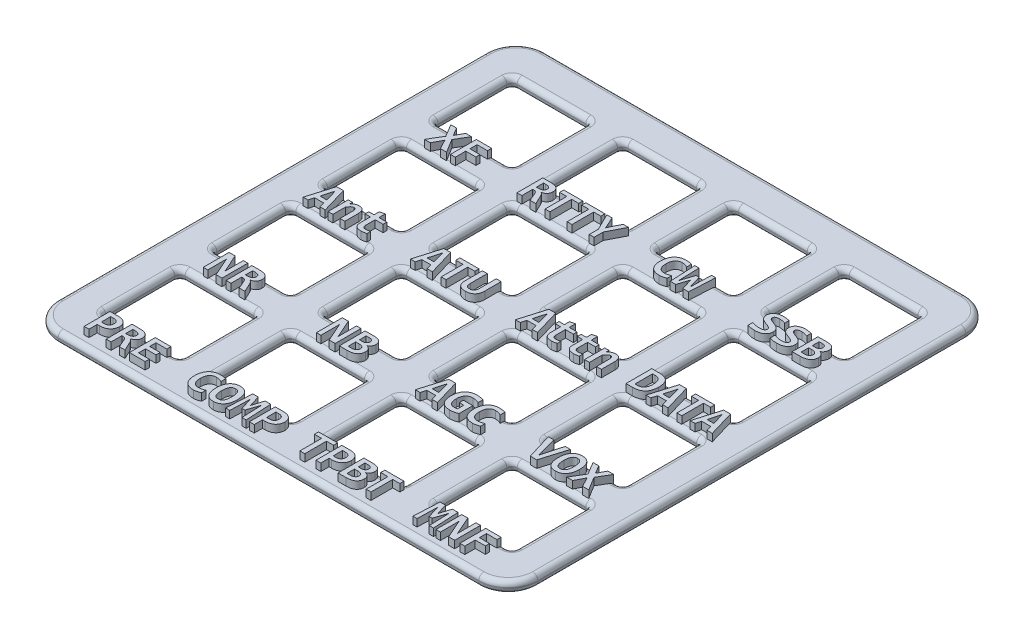
from build123d import *

# Parameters (mm, degrees)
MAIN_DEPTH                       = 1.5
SKETCH2_W                        = 10.7
SKETCH2_H                        = 10.7
BUTTON_HOLE_1_DEPTH              = 93.818144147
BUTTON_FILLET_R                  = 0.7
BUTTONS_BY_16_COUNT              = 4
BUTTONS_BY_16_PITCH              = 15
BUTTONS_BY_16_COUNT_DIR2         = 4
BUTTONS_BY_16_PITCH_DIR2         = 15
BUTTON_FILLET_OF_BUTTONS_BY_16_R = 0.7
OUTER_EDGE_FILLET_R              = 0.7
LETTERING_BOSS_DEPTH             = 2.5


with BuildPart() as part:
    # Sketch1 → main (new body)
    with BuildSketch(Plane(origin=(0, 0, 0), x_dir=(1, 0, 0), z_dir=(0, 1, 0))):
        with BuildLine():
            Line((-14.880741165, -14.535531583), (42.119258835, -14.535531583))
            ThreePointArc((42.119258835, -14.535531583), (44.94768596, -15.707104458), (46.119258835, -18.535531583))
            Line((46.119258835, -18.535531583), (46.119258835, -76.535531583))
            ThreePointArc((46.119258835, -76.535531583), (44.94768596, -79.363958708), (42.119258835, -80.535531583))
            Line((42.119258835, -80.535531583), (-14.880741165, -80.535531583))
            ThreePointArc((-14.880741165, -80.535531583), (-17.709168289, -79.363958708), (-18.880741165, -76.535531583))
            Line((-18.880741165, -76.535531583), (-18.880741165, -18.535531583))
            ThreePointArc((-18.880741165, -18.535531583), (-17.709168289, -15.707104458), (-14.880741165, -14.535531583))
        make_face()
    extrude(amount=MAIN_DEPTH)

    # Sketch2 → button hole 1 (cut, through all)
    with BuildSketch(Plane(origin=(0, 1.5, 0), x_dir=(1, 0, 0), z_dir=(0, 1, 0))):
        with Locations((-8.880741165, -25.035531583)):
            Rectangle(SKETCH2_W, SKETCH2_H)
    button_hole_1 = extrude(amount=-BUTTON_HOLE_1_DEPTH, mode=Mode.SUBTRACT)

    # button fillet
    button_fillet_edges = [part.edges().sort_by_distance(p)[0] for p in [
        (-8.880741165, 0, 30.385531583),
        (-8.880741165, 1.5, 30.385531583),
        (-8.880741165, 0, 19.685531583),
        (-8.880741165, 1.5, 19.685531583),
        (-3.530741165, 0.75, 30.385531583),
        (-3.530741165, 0, 25.035531583),
        (-3.530741165, 0.75, 19.685531583),
        (-3.530741165, 1.5, 25.035531583),
        (-14.230741165, 0.75, 19.685531583),
        (-14.230741165, 0, 25.035531583),
        (-14.230741165, 0.75, 30.385531583),
        (-14.230741165, 1.5, 25.035531583),
    ]]
    fillet(button_fillet_edges, radius=BUTTON_FILLET_R)

    # buttons by 16: button hole 1 4 × 4
    with Locations(*[(i * BUTTONS_BY_16_PITCH, 0, j * BUTTONS_BY_16_PITCH_DIR2) for i in range(BUTTONS_BY_16_COUNT) for j in range(BUTTONS_BY_16_COUNT_DIR2) if (i, j) != (0, 0)]):
        add(button_hole_1, mode=Mode.SUBTRACT)

    # button fillet of buttons by 16
    button_fillet_of_buttons_by_16_edges = [part.edges().sort_by_distance(p)[0] for p in [
        (-8.880741165, 0, 45.385531583),
        (-8.880741165, 1.5, 45.385531583),
        (-8.880741165, 0, 34.685531583),
        (-8.880741165, 1.5, 34.685531583),
        (-3.530741165, 0.75, 45.385531583),
        (-3.530741165, 0, 40.035531583),
        (-3.530741165, 0.75, 34.685531583),
        (-3.530741165, 1.5, 40.035531583),
        (-14.230741165, 0.75, 34.685531583),
        (-14.230741165, 0, 40.035531583),
        (-14.230741165, 0.75, 45.385531583),
        (-14.230741165, 1.5, 40.035531583),
        (-8.880741165, 0, 60.385531583),
        (-8.880741165, 1.5, 60.385531583),
        (-8.880741165, 0, 49.685531583),
        (-8.880741165, 1.5, 49.685531583),
        (-3.530741165, 0.75, 60.385531583),
        (-3.530741165, 0, 55.035531583),
        (-3.530741165, 0.75, 49.685531583),
        (-3.530741165, 1.5, 55.035531583),
        (-14.230741165, 0.75, 49.685531583),
        (-14.230741165, 0, 55.035531583),
        (-14.230741165, 0.75, 60.385531583),
        (-14.230741165, 1.5, 55.035531583),
        (-8.880741165, 0, 75.385531583),
        (-8.880741165, 1.5, 75.385531583),
        (-8.880741165, 0, 64.685531583),
        (-8.880741165, 1.5, 64.685531583),
        (-3.530741165, 0.75, 75.385531583),
        (-3.530741165, 0, 70.035531583),
        (-3.530741165, 0.75, 64.685531583),
        (-3.530741165, 1.5, 70.035531583),
        (-14.230741165, 0.75, 64.685531583),
        (-14.230741165, 0, 70.035531583),
        (-14.230741165, 0.75, 75.385531583),
        (-14.230741165, 1.5, 70.035531583),
        (6.119258835, 0, 30.385531583),
        (6.119258835, 1.5, 30.385531583),
        (6.119258835, 0, 19.685531583),
        (6.119258835, 1.5, 19.685531583),
        (11.469258835, 0.75, 30.385531583),
        (11.469258835, 0, 25.035531583),
        (11.469258835, 0.75, 19.685531583),
        (11.469258835, 1.5, 25.035531583),
        (0.769258835, 0.75, 19.685531583),
        (0.769258835, 0, 25.035531583),
        (0.769258835, 0.75, 30.385531583),
        (0.769258835, 1.5, 25.035531583),
        (6.119258835, 0, 45.385531583),
        (6.119258835, 1.5, 45.385531583),
        (6.119258835, 0, 34.685531583),
        (6.119258835, 1.5, 34.685531583),
        (11.469258835, 0.75, 45.385531583),
        (11.469258835, 0, 40.035531583),
        (11.469258835, 0.75, 34.685531583),
        (11.469258835, 1.5, 40.035531583),
        (0.769258835, 0.75, 34.685531583),
        (0.769258835, 0, 40.035531583),
        (0.769258835, 0.75, 45.385531583),
        (0.769258835, 1.5, 40.035531583),
        (6.119258835, 0, 60.385531583),
        (6.119258835, 1.5, 60.385531583),
        (6.119258835, 0, 49.685531583),
        (6.119258835, 1.5, 49.685531583),
        (11.469258835, 0.75, 60.385531583),
        (11.469258835, 0, 55.035531583),
        (11.469258835, 0.75, 49.685531583),
        (11.469258835, 1.5, 55.035531583),
        (0.769258835, 0.75, 49.685531583),
        (0.769258835, 0, 55.035531583),
        (0.769258835, 0.75, 60.385531583),
        (0.769258835, 1.5, 55.035531583),
        (6.119258835, 0, 75.385531583),
        (6.119258835, 1.5, 75.385531583),
        (6.119258835, 0, 64.685531583),
        (6.119258835, 1.5, 64.685531583),
        (11.469258835, 0.75, 75.385531583),
        (11.469258835, 0, 70.035531583),
        (11.469258835, 0.75, 64.685531583),
        (11.469258835, 1.5, 70.035531583),
        (0.769258835, 0.75, 64.685531583),
        (0.769258835, 0, 70.035531583),
        (0.769258835, 0.75, 75.385531583),
        (0.769258835, 1.5, 70.035531583),
        (21.119258835, 0, 30.385531583),
        (21.119258835, 1.5, 30.385531583),
        (21.119258835, 0, 19.685531583),
        (21.119258835, 1.5, 19.685531583),
        (26.469258835, 0.75, 30.385531583),
        (26.469258835, 0, 25.035531583),
        (26.469258835, 0.75, 19.685531583),
        (26.469258835, 1.5, 25.035531583),
        (15.769258835, 0.75, 19.685531583),
        (15.769258835, 0, 25.035531583),
        (15.769258835, 0.75, 30.385531583),
        (15.769258835, 1.5, 25.035531583),
        (21.119258835, 0, 45.385531583),
        (21.119258835, 1.5, 45.385531583),
        (21.119258835, 0, 34.685531583),
        (21.119258835, 1.5, 34.685531583),
        (26.469258835, 0.75, 45.385531583),
        (26.469258835, 0, 40.035531583),
        (26.469258835, 0.75, 34.685531583),
        (26.469258835, 1.5, 40.035531583),
        (15.769258835, 0.75, 34.685531583),
        (15.769258835, 0, 40.035531583),
        (15.769258835, 0.75, 45.385531583),
        (15.769258835, 1.5, 40.035531583),
        (21.119258835, 0, 60.385531583),
        (21.119258835, 1.5, 60.385531583),
        (21.119258835, 0, 49.685531583),
        (21.119258835, 1.5, 49.685531583),
        (26.469258835, 0.75, 60.385531583),
        (26.469258835, 0, 55.035531583),
        (26.469258835, 0.75, 49.685531583),
        (26.469258835, 1.5, 55.035531583),
        (15.769258835, 0.75, 49.685531583),
        (15.769258835, 0, 55.035531583),
        (15.769258835, 0.75, 60.385531583),
        (15.769258835, 1.5, 55.035531583),
        (21.119258835, 0, 75.385531583),
        (21.119258835, 1.5, 75.385531583),
        (21.119258835, 0, 64.685531583),
        (21.119258835, 1.5, 64.685531583),
        (26.469258835, 0.75, 75.385531583),
        (26.469258835, 0, 70.035531583),
        (26.469258835, 0.75, 64.685531583),
        (26.469258835, 1.5, 70.035531583),
        (15.769258835, 0.75, 64.685531583),
        (15.769258835, 0, 70.035531583),
        (15.769258835, 0.75, 75.385531583),
        (15.769258835, 1.5, 70.035531583),
        (36.119258835, 0, 30.385531583),
        (36.119258835, 1.5, 30.385531583),
        (36.119258835, 0, 19.685531583),
        (36.119258835, 1.5, 19.685531583),
        (41.469258835, 0.75, 30.385531583),
        (41.469258835, 0, 25.035531583),
        (41.469258835, 0.75, 19.685531583),
        (41.469258835, 1.5, 25.035531583),
        (30.769258835, 0.75, 19.685531583),
        (30.769258835, 0, 25.035531583),
        (30.769258835, 0.75, 30.385531583),
        (30.769258835, 1.5, 25.035531583),
        (36.119258835, 0, 45.385531583),
        (36.119258835, 1.5, 45.385531583),
        (36.119258835, 0, 34.685531583),
        (36.119258835, 1.5, 34.685531583),
        (41.469258835, 0.75, 45.385531583),
        (41.469258835, 0, 40.035531583),
        (41.469258835, 0.75, 34.685531583),
        (41.469258835, 1.5, 40.035531583),
        (30.769258835, 0.75, 34.685531583),
        (30.769258835, 0, 40.035531583),
        (30.769258835, 0.75, 45.385531583),
        (30.769258835, 1.5, 40.035531583),
        (36.119258835, 0, 60.385531583),
        (36.119258835, 1.5, 60.385531583),
        (36.119258835, 0, 49.685531583),
        (36.119258835, 1.5, 49.685531583),
        (41.469258835, 0.75, 60.385531583),
        (41.469258835, 0, 55.035531583),
        (41.469258835, 0.75, 49.685531583),
        (41.469258835, 1.5, 55.035531583),
        (30.769258835, 0.75, 49.685531583),
        (30.769258835, 0, 55.035531583),
        (30.769258835, 0.75, 60.385531583),
        (30.769258835, 1.5, 55.035531583),
        (36.119258835, 0, 75.385531583),
        (36.119258835, 1.5, 75.385531583),
        (36.119258835, 0, 64.685531583),
        (36.119258835, 1.5, 64.685531583),
        (41.469258835, 0.75, 75.385531583),
        (41.469258835, 0, 70.035531583),
        (41.469258835, 0.75, 64.685531583),
        (41.469258835, 1.5, 70.035531583),
        (30.769258835, 0.75, 64.685531583),
        (30.769258835, 0, 70.035531583),
        (30.769258835, 0.75, 75.385531583),
        (30.769258835, 1.5, 70.035531583),
    ]]
    fillet(button_fillet_of_buttons_by_16_edges, radius=BUTTON_FILLET_OF_BUTTONS_BY_16_R)

    # outer edge fillet
    outer_edge_fillet_edges = [part.edges().sort_by_distance(p)[0] for p in [
        (13.619258835, 1.5, 14.535531583),
        (13.619258835, 0, 14.535531583),
        (46.119258835, 1.5, 47.535531583),
        (46.119258835, 0, 47.535531583),
        (13.619258835, 1.5, 80.535531583),
        (13.619258835, 0, 80.535531583),
        (-18.880741165, 1.5, 47.535531583),
        (-18.880741165, 0, 47.535531583),
        (44.94768596, 1.5, 15.707104458),
        (44.94768596, 1.5, 79.363958708),
        (-17.709168289, 1.5, 79.363958708),
        (-17.709168289, 1.5, 15.707104458),
        (44.94768596, 0, 15.707104458),
        (44.94768596, 0, 79.363958708),
        (-17.709168289, 0, 79.363958708),
        (-17.709168289, 0, 15.707104458),
    ]]
    fillet(outer_edge_fillet_edges, radius=OUTER_EDGE_FILLET_R)

    # Lettering → lettering boss (add)
    # profile 1 of 49: a face of its own
    with BuildSketch(Plane(origin=(0, 0, 0), x_dir=(1, 0, 0), z_dir=(0, 1, 0))):
        with BuildLine():
            add(Edge.make_bspline(
                [(34.582049799, -33.072691909), (34.581076741, -33.118754507), (34.579187106, -33.208205957), (34.557540627, -33.337558753), (34.525003451, -33.458150303), (34.477728217, -33.569020514), (34.418706756, -33.670145601), (34.349128038, -33.762346077), (34.268706197, -33.84512241), (34.177533785, -33.918182679), (34.077058927, -33.982599991), (33.967420708, -34.03817851), (33.848213616, -34.083922022), (33.721006683, -34.121727685), (33.586119828, -34.150939713), (33.444661194, -34.171063334), (33.297014773, -34.184325826), (33.196398725, -34.185604497), (33.145115922, -34.186256221)],
                knots=[0, 0, 0, 0, 1.073681499, 2.085040185, 3.051149047, 3.981944283, 4.887978953, 5.776845786, 6.670466122, 7.573455289, 8.49677068, 9.450589821, 10.436166866, 11.471749255, 12.544173733, 13.653021529, 14.803772988, 16, 16, 16, 16], degree=3))
            add(Edge.make_bspline(
                [(33.145115922, -34.186256221), (33.054174344, -34.184576543), (32.87481318, -34.181263769), (32.609424863, -34.155083882), (32.349533611, -34.108055718), (32.181236538, -34.058846435), (32.096542553, -34.034082307)],
                knots=[0, 0, 0, 0, 1.025764599, 2.023082686, 3.005134181, 4, 4, 4, 4], degree=3))
            Line((32.096542553, -34.034082307), (32.096542553, -33.374662018))
            add(Edge.make_bspline(
                [(32.096542553, -33.374662018), (32.139296465, -33.388274658), (32.226103698, -33.415913665), (32.358384291, -33.455161652), (32.494266198, -33.488440968), (32.630965393, -33.519067388), (32.76797699, -33.54339105), (32.904032598, -33.562708611), (33.037889106, -33.575143008), (33.126333382, -33.576765352), (33.169685669, -33.577560568)],
                knots=[0, 0, 0, 0, 0.982138956, 1.994127776, 3.019379675, 4.043652595, 5.060010385, 6.064286964, 7.051181246, 8, 8, 8, 8], degree=3))
            add(Edge.make_bspline(
                [(33.169685669, -33.577560568), (33.20034024, -33.577344081), (33.259063588, -33.576929368), (33.34374019, -33.571371353), (33.420969416, -33.561920475), (33.491771694, -33.549490037), (33.55545218, -33.532763313), (33.613366496, -33.513882948), (33.664750852, -33.491729123), (33.710685488, -33.467217621), (33.750049865, -33.439492495), (33.784335176, -33.409932443), (33.812177872, -33.377177044), (33.841854854, -33.330630302), (33.866661535, -33.265164811), (33.870139523, -33.210044658), (33.871904872, -33.182066909)],
                knots=[0, 0, 0, 0, 1.428616996, 2.73672639, 3.952495327, 5.053878092, 6.0842745, 7.018828766, 7.890331589, 8.689308687, 9.440856164, 10.130100935, 10.793906804, 11.436117796, 12.698631087, 14, 14, 14, 14], degree=3))
            add(Edge.make_bspline(
                [(33.871904872, -33.182066909), (33.870950495, -33.161661255), (33.86909397, -33.121966637), (33.855834531, -33.064648206), (33.831258763, -33.013113569), (33.798179773, -32.966756363), (33.757408447, -32.924783594), (33.712033163, -32.883974108), (33.658695533, -32.848048065), (33.580013434, -32.800395294), (33.468703905, -32.747085562), (33.3224432, -32.693270589), (33.16754609, -32.638936463), (33.00827227, -32.581490004), (32.849753719, -32.515390595), (32.718632384, -32.456259305), (32.61777978, -32.401704077), (32.546584519, -32.355764053), (32.479501075, -32.305232749), (32.415855208, -32.251068159), (32.357748786, -32.190722285), (32.306319866, -32.12446183), (32.259811271, -32.053357109), (32.219157732, -31.976509382), (32.185911439, -31.892254134), (32.163528206, -31.799998883), (32.149902823, -31.699835006), (32.148167745, -31.630520469), (32.14726719, -31.594544264)],
                knots=[0, 0, 0, 0, 0.628577789, 1.222756944, 1.798018064, 2.376093337, 2.969100815, 3.597678604, 4.252424917, 4.946124793, 6.431204757, 8.043936516, 9.745465074, 11.488681512, 13.25853968, 15.035457213, 15.916880054, 16.788288763, 17.642849837, 18.502665518, 19.360321436, 20.218324825, 21.082903639, 21.974822425, 22.892221362, 23.865363472, 24.892063288, 26, 26, 26, 26], degree=3))
            add(Edge.make_bspline(
                [(32.14726719, -31.594544264), (32.148130911, -31.560670177), (32.149839203, -31.493673001), (32.165008913, -31.394792401), (32.187488222, -31.298171014), (32.220976812, -31.205000982), (32.263484695, -31.115346769), (32.318126096, -31.031893245), (32.382520624, -30.95351691), (32.458626531, -30.881972697), (32.545419801, -30.816652376), (32.643869093, -30.75903275), (32.752825401, -30.707026656), (32.874037539, -30.663973457), (33.007082034, -30.62760361), (33.153397817, -30.603386426), (33.312493913, -30.586761566), (33.42299684, -30.585474986), (33.480374075, -30.584806945)],
                knots=[0, 0, 0, 0, 0.86106195, 1.703033948, 2.539139973, 3.380790137, 4.216301896, 5.056905248, 5.911254958, 6.790607679, 7.707171391, 8.668295362, 9.687250551, 10.773449095, 11.935660323, 13.190638171, 14.54127474, 16, 16, 16, 16], degree=3))
            add(Edge.make_bspline(
                [(33.480374075, -30.584806945), (33.516049398, -30.585328122), (33.58903633, -30.586394381), (33.699753688, -30.593192523), (33.812104853, -30.602352865), (33.923574361, -30.615291702), (34.0325124, -30.62997727), (34.137008163, -30.647768483), (34.235542222, -30.665116669), (34.298357394, -30.67941277), (34.328426611, -30.686256221)],
                knots=[0, 0, 0, 0, 1.000632186, 2.047159369, 3.110551158, 4.162103459, 5.194366354, 6.193323381, 7.135155576, 8, 8, 8, 8], degree=3))
            Line((34.328426611, -30.686256221), (34.328426611, -31.294951873))
            add(Edge.make_bspline(
                [(34.328426611, -31.294951873), (34.298411043, -31.284076418), (34.236246124, -31.261552381), (34.138739245, -31.233039217), (34.035753632, -31.206571669), (33.928801405, -31.184965323), (33.819690314, -31.166419449), (33.71069605, -31.153504356), (33.604186546, -31.143838304), (33.534289541, -31.143125648), (33.500188386, -31.14277796)],
                knots=[0, 0, 0, 0, 0.905300762, 1.874958649, 2.879989676, 3.920459461, 4.968805495, 6.018141936, 7.033096622, 8, 8, 8, 8], degree=3))
            add(Edge.make_bspline(
                [(33.500188386, -31.14277796), (33.472171141, -31.142973959), (33.418189786, -31.143351593), (33.340718373, -31.149221763), (33.269663043, -31.157352156), (33.205502782, -31.170438094), (33.14705567, -31.185096368), (33.094713691, -31.20350348), (33.047268354, -31.223964621), (33.005447187, -31.247790061), (32.968248157, -31.273528612), (32.937871235, -31.303956514), (32.911315751, -31.335782043), (32.885129719, -31.383308933), (32.861866359, -31.448817433), (32.858925236, -31.504220459), (32.857412118, -31.532723612)],
                knots=[0, 0, 0, 0, 1.388230333, 2.674729552, 3.848979118, 4.930101904, 5.917823404, 6.833012122, 7.677256906, 8.474713018, 9.216010271, 9.910495862, 10.599653, 11.262301414, 12.591538262, 14, 14, 14, 14], degree=3))
            add(Edge.make_bspline(
                [(32.857412118, -31.532723612), (32.858312422, -31.550519959), (32.860060251, -31.585069351), (32.874199422, -31.634928436), (32.897398283, -31.680867781), (32.930833896, -31.722004976), (32.971176092, -31.760011163), (33.017127727, -31.796655217), (33.069841173, -31.830353208), (33.148964034, -31.87474687), (33.260507311, -31.92480093), (33.405510236, -31.981066224), (33.561420943, -32.034816895), (33.72055588, -32.095990815), (33.880729376, -32.161027453), (34.01057, -32.224533677), (34.111592303, -32.279743737), (34.18273587, -32.32656744), (34.24987699, -32.377817306), (34.313023724, -32.432762858), (34.371522742, -32.492554967), (34.424078637, -32.557665228), (34.469932487, -32.628483676), (34.510088864, -32.704335812), (34.543010759, -32.786142297), (34.565957054, -32.875348129), (34.579313361, -32.971628224), (34.581118693, -33.03830377), (34.582049799, -33.072691909)],
                knots=[0, 0, 0, 0, 0.557156268, 1.081649532, 1.611348813, 2.159818371, 2.733894156, 3.347031838, 3.999468898, 4.692937397, 6.19005387, 7.82657883, 9.568786128, 11.359307707, 13.171290529, 14.986394118, 15.88741221, 16.778746798, 17.653416553, 18.53387112, 19.400741367, 20.27258301, 21.152453011, 22.041629961, 22.959843454, 23.910073311, 24.922113205, 26, 26, 26, 26], degree=3))
        make_face()
    # profile 2 of 49: a face of its own
    with BuildSketch(Plane(origin=(0, 0, 0), x_dir=(1, 0, 0), z_dir=(0, 1, 0))):
        with BuildLine():
            add(Edge.make_bspline(
                [(37.574803422, -33.072691909), (37.573830364, -33.118754507), (37.57194073, -33.208205957), (37.55029425, -33.337558753), (37.517757074, -33.458150303), (37.470481841, -33.569020514), (37.411460379, -33.670145601), (37.341881661, -33.762346077), (37.26145982, -33.84512241), (37.170287409, -33.918182679), (37.06981255, -33.982599991), (36.960174331, -34.03817851), (36.840967239, -34.083922022), (36.713760306, -34.121727685), (36.578873451, -34.150939713), (36.437414817, -34.171063334), (36.289768396, -34.184325826), (36.189152348, -34.185604497), (36.137869546, -34.186256221)],
                knots=[0, 0, 0, 0, 1.073681499, 2.085040185, 3.051149047, 3.981944283, 4.887978953, 5.776845786, 6.670466122, 7.573455289, 8.49677068, 9.450589821, 10.436166866, 11.471749255, 12.544173733, 13.653021529, 14.803772988, 16, 16, 16, 16], degree=3))
            add(Edge.make_bspline(
                [(36.137869546, -34.186256221), (36.046927967, -34.184576543), (35.867566804, -34.181263769), (35.602178486, -34.155083882), (35.342287235, -34.108055718), (35.173990161, -34.058846435), (35.089296176, -34.034082307)],
                knots=[0, 0, 0, 0, 1.025764599, 2.023082686, 3.005134181, 4, 4, 4, 4], degree=3))
            Line((35.089296176, -34.034082307), (35.089296176, -33.374662018))
            add(Edge.make_bspline(
                [(35.089296176, -33.374662018), (35.132050089, -33.388274658), (35.218857321, -33.415913665), (35.351137914, -33.455161652), (35.487019822, -33.488440968), (35.623719016, -33.519067388), (35.760730613, -33.54339105), (35.896786221, -33.562708611), (36.03064273, -33.575143008), (36.119087005, -33.576765352), (36.162439292, -33.577560568)],
                knots=[0, 0, 0, 0, 0.982138956, 1.994127776, 3.019379675, 4.043652595, 5.060010385, 6.064286964, 7.051181246, 8, 8, 8, 8], degree=3))
            add(Edge.make_bspline(
                [(36.162439292, -33.577560568), (36.193093863, -33.577344081), (36.251817211, -33.576929368), (36.336493813, -33.571371353), (36.413723039, -33.561920475), (36.484525317, -33.549490037), (36.548205803, -33.532763313), (36.606120119, -33.513882948), (36.657504476, -33.491729123), (36.703439111, -33.467217621), (36.742803489, -33.439492495), (36.777088799, -33.409932443), (36.804931496, -33.377177044), (36.834608478, -33.330630302), (36.859415159, -33.265164811), (36.862893146, -33.210044658), (36.864658495, -33.182066909)],
                knots=[0, 0, 0, 0, 1.428616996, 2.73672639, 3.952495327, 5.053878092, 6.0842745, 7.018828766, 7.890331589, 8.689308687, 9.440856164, 10.130100935, 10.793906804, 11.436117796, 12.698631087, 14, 14, 14, 14], degree=3))
            add(Edge.make_bspline(
                [(36.864658495, -33.182066909), (36.863704118, -33.161661255), (36.861847593, -33.121966637), (36.848588154, -33.064648206), (36.824012386, -33.013113569), (36.790933397, -32.966756363), (36.750162071, -32.924783594), (36.704786786, -32.883974108), (36.651449156, -32.848048065), (36.572767057, -32.800395294), (36.461457528, -32.747085562), (36.315196823, -32.693270589), (36.160299713, -32.638936463), (36.001025893, -32.581490004), (35.842507342, -32.515390595), (35.711386007, -32.456259305), (35.610533403, -32.401704077), (35.539338142, -32.355764053), (35.472254699, -32.305232749), (35.408608831, -32.251068159), (35.350502409, -32.190722285), (35.299073489, -32.12446183), (35.252564894, -32.053357109), (35.211911356, -31.976509382), (35.178665062, -31.892254134), (35.156281829, -31.799998883), (35.142656446, -31.699835006), (35.140921368, -31.630520469), (35.140020814, -31.594544264)],
                knots=[0, 0, 0, 0, 0.628577789, 1.222756944, 1.798018064, 2.376093337, 2.969100815, 3.597678604, 4.252424917, 4.946124793, 6.431204757, 8.043936516, 9.745465074, 11.488681512, 13.25853968, 15.035457213, 15.916880054, 16.788288763, 17.642849837, 18.502665518, 19.360321436, 20.218324825, 21.082903639, 21.974822425, 22.892221362, 23.865363472, 24.892063288, 26, 26, 26, 26], degree=3))
            add(Edge.make_bspline(
                [(35.140020814, -31.594544264), (35.140884534, -31.560670177), (35.142592826, -31.493673001), (35.157762536, -31.394792401), (35.180241845, -31.298171014), (35.213730435, -31.205000982), (35.256238318, -31.115346769), (35.310879719, -31.031893245), (35.375274247, -30.95351691), (35.451380154, -30.881972697), (35.538173424, -30.816652376), (35.636622717, -30.75903275), (35.745579024, -30.707026656), (35.866791162, -30.663973457), (35.999835657, -30.62760361), (36.14615144, -30.603386426), (36.305247536, -30.586761566), (36.415750464, -30.585474986), (36.473127698, -30.584806945)],
                knots=[0, 0, 0, 0, 0.86106195, 1.703033948, 2.539139973, 3.380790137, 4.216301896, 5.056905248, 5.911254958, 6.790607679, 7.707171391, 8.668295362, 9.687250551, 10.773449095, 11.935660323, 13.190638171, 14.54127474, 16, 16, 16, 16], degree=3))
            add(Edge.make_bspline(
                [(36.473127698, -30.584806945), (36.508803021, -30.585328122), (36.581789953, -30.586394381), (36.692507311, -30.593192523), (36.804858476, -30.602352865), (36.916327984, -30.615291702), (37.025266023, -30.62997727), (37.129761786, -30.647768483), (37.228295845, -30.665116669), (37.291111017, -30.67941277), (37.321180234, -30.686256221)],
                knots=[0, 0, 0, 0, 1.000632186, 2.047159369, 3.110551158, 4.162103459, 5.194366354, 6.193323381, 7.135155576, 8, 8, 8, 8], degree=3))
            Line((37.321180234, -30.686256221), (37.321180234, -31.294951873))
            add(Edge.make_bspline(
                [(37.321180234, -31.294951873), (37.291164666, -31.284076418), (37.228999747, -31.261552381), (37.131492869, -31.233039217), (37.028507255, -31.206571669), (36.921555028, -31.184965323), (36.812443937, -31.166419449), (36.703449674, -31.153504356), (36.596940169, -31.143838304), (36.527043165, -31.143125648), (36.492942009, -31.14277796)],
                knots=[0, 0, 0, 0, 0.905300762, 1.874958649, 2.879989676, 3.920459461, 4.968805495, 6.018141936, 7.033096622, 8, 8, 8, 8], degree=3))
            add(Edge.make_bspline(
                [(36.492942009, -31.14277796), (36.464924764, -31.142973959), (36.410943409, -31.143351593), (36.333471997, -31.149221763), (36.262416666, -31.157352156), (36.198256406, -31.170438094), (36.139809293, -31.185096368), (36.087467314, -31.20350348), (36.040021977, -31.223964621), (35.99820081, -31.247790061), (35.96100178, -31.273528612), (35.930624858, -31.303956514), (35.904069374, -31.335782043), (35.877883342, -31.383308933), (35.854619982, -31.448817433), (35.851678859, -31.504220459), (35.850165741, -31.532723612)],
                knots=[0, 0, 0, 0, 1.388230333, 2.674729552, 3.848979118, 4.930101904, 5.917823404, 6.833012122, 7.677256906, 8.474713018, 9.216010271, 9.910495862, 10.599653, 11.262301414, 12.591538262, 14, 14, 14, 14], degree=3))
            add(Edge.make_bspline(
                [(35.850165741, -31.532723612), (35.851066046, -31.550519959), (35.852813874, -31.585069351), (35.866953045, -31.634928436), (35.890151906, -31.680867781), (35.923587519, -31.722004976), (35.963929715, -31.760011163), (36.00988135, -31.796655217), (36.062594796, -31.830353208), (36.141717657, -31.87474687), (36.253260934, -31.92480093), (36.398263859, -31.981066224), (36.554174566, -32.034816895), (36.713309503, -32.095990815), (36.873482999, -32.161027453), (37.003323623, -32.224533677), (37.104345926, -32.279743737), (37.175489493, -32.32656744), (37.242630614, -32.377817306), (37.305777347, -32.432762858), (37.364276366, -32.492554967), (37.41683226, -32.557665228), (37.462686111, -32.628483676), (37.502842487, -32.704335812), (37.535764382, -32.786142297), (37.558710678, -32.875348129), (37.572066984, -32.971628224), (37.573872316, -33.03830377), (37.574803422, -33.072691909)],
                knots=[0, 0, 0, 0, 0.557156268, 1.081649532, 1.611348813, 2.159818371, 2.733894156, 3.347031838, 3.999468898, 4.692937397, 6.19005387, 7.82657883, 9.568786128, 11.359307707, 13.171290529, 14.986394118, 15.88741221, 16.778746798, 17.653416553, 18.53387112, 19.400741367, 20.27258301, 21.152453011, 22.041629961, 22.959843454, 23.910073311, 24.922113205, 26, 26, 26, 26], degree=3))
        make_face()
    # profile 3 of 49: a face of its own
    with BuildSketch(Plane(origin=(0, 0, 0), x_dir=(1, 0, 0), z_dir=(0, 1, 0))):
        with BuildLine():
            Line((38.183499075, -34.135531583), (38.183499075, -30.635531583))
            Line((38.183499075, -30.635531583), (39.31767027, -30.635531583))
            add(Edge.make_bspline(
                [(39.31767027, -30.635531583), (39.366034995, -30.636098997), (39.459956891, -30.637200886), (39.595929376, -30.646831719), (39.722845289, -30.662103475), (39.839951392, -30.685470439), (39.948494247, -30.713092876), (40.046984379, -30.749469373), (40.137275363, -30.789675513), (40.217115608, -30.838884443), (40.288238201, -30.893170298), (40.349440754, -30.955192176), (40.400750908, -31.023765881), (40.444865535, -31.098126161), (40.476700942, -31.180270745), (40.499694847, -31.268578041), (40.514333116, -31.363157751), (40.515984216, -31.428577606), (40.516832408, -31.462184663)],
                knots=[0, 0, 0, 0, 1.402020869, 2.722654989, 3.950110139, 5.105271457, 6.182839017, 7.193223738, 8.145991228, 9.043198014, 9.905766409, 10.734443583, 11.560141935, 12.38384842, 13.232981204, 14.104313047, 15.026160196, 16, 16, 16, 16], degree=3))
            add(Edge.make_bspline(
                [(40.516832408, -31.462184663), (40.515229429, -31.504813464), (40.512039912, -31.58963387), (40.488952569, -31.714076062), (40.449590688, -31.83209865), (40.392909446, -31.94074928), (40.320010759, -32.038790152), (40.245809449, -32.109755322), (40.178589145, -32.158978767), (40.123709857, -32.192666373), (40.064012558, -32.221083099), (40.022131107, -32.236583879), (40.000867734, -32.244453684)],
                knots=[0, 0, 0, 0, 1.273298406, 2.533538006, 3.766639183, 4.977638108, 6.179029059, 7.401702507, 8.028476186, 8.666091093, 9.322769338, 10, 10, 10, 10], degree=3))
            add(Edge.make_bspline(
                [(40.000867734, -32.244453684), (40.04494973, -32.253415804), (40.133693339, -32.271457884), (40.237411429, -32.318521271), (40.316850628, -32.362677478), (40.371340102, -32.403312963), (40.423656822, -32.446555681), (40.470720881, -32.496071487), (40.514796425, -32.54913733), (40.553603281, -32.607005498), (40.587110323, -32.669844968), (40.616302257, -32.736781767), (40.640350028, -32.807971431), (40.656838138, -32.883719883), (40.667455251, -32.963276751), (40.668483923, -33.017969474), (40.669006321, -33.045744445)],
                knots=[0, 0, 0, 0, 1.6519262, 3.32557291, 4.166740498, 4.995835318, 5.824301884, 6.663779587, 7.507195088, 8.362647254, 9.224604015, 10.126598034, 11.049652309, 11.986803716, 12.977625078, 14, 14, 14, 14], degree=3))
            add(Edge.make_bspline(
                [(40.669006321, -33.045744445), (40.668099313, -33.089669343), (40.666332266, -33.175244507), (40.648076382, -33.299103252), (40.621092367, -33.414986027), (40.581380806, -33.522200043), (40.529060648, -33.620157753), (40.467307521, -33.710946587), (40.392481452, -33.792076902), (40.307270509, -33.865448196), (40.211070012, -33.929637807), (40.104224755, -33.984086709), (39.988717644, -34.032123105), (39.862339148, -34.069455019), (39.726621546, -34.100136652), (39.580160147, -34.119394737), (39.424166528, -34.133966189), (39.316651888, -34.135000187), (39.261397625, -34.135531583)],
                knots=[0, 0, 0, 0, 1.039371005, 2.024918617, 2.958047709, 3.852767572, 4.723053758, 5.582001921, 6.445494094, 7.328259018, 8.239147345, 9.176460892, 10.16391264, 11.196919877, 12.292741297, 13.455226912, 14.692182175, 16, 16, 16, 16], degree=3))
            Line((39.261397625, -34.135531583), (38.183499075, -34.135531583))
        make_face()
        with BuildLine():
            add(Edge.make_bspline(
                [(39.80668748, -31.569974518), (39.805257956, -31.53891651), (39.802487328, -31.478721492), (39.782210817, -31.40650229), (39.757607911, -31.35504987), (39.735100457, -31.319357793), (39.707488446, -31.286895266), (39.674154463, -31.258265835), (39.636902256, -31.231922328), (39.594534142, -31.209016138), (39.547318433, -31.189043088), (39.494962961, -31.172754776), (39.437572872, -31.158972472), (39.374418829, -31.150014365), (39.305667506, -31.143134329), (39.257718846, -31.14289962), (39.232865017, -31.14277796)],
                knots=[0, 0, 0, 0, 1.599357931, 3.099792517, 3.824733362, 4.535069213, 5.269290696, 6.012427379, 6.794603599, 7.61746315, 8.490210935, 9.433542011, 10.441150938, 11.529478764, 12.719423833, 14, 14, 14, 14], degree=3))
            Line((39.232865017, -31.14277796), (38.842919364, -31.14277796))
            Line((38.842919364, -31.14277796), (38.842919364, -32.055821438))
            Line((38.842919364, -32.055821438), (39.232865017, -32.055821438))
            add(Edge.make_bspline(
                [(39.232865017, -32.055821438), (39.258245017, -32.055404031), (39.306999963, -32.054602193), (39.376980875, -32.047461043), (39.440668338, -32.03577893), (39.498437574, -32.019327924), (39.55023348, -31.997195067), (39.597691973, -31.973436582), (39.639815984, -31.944934479), (39.688731101, -31.903296933), (39.740129267, -31.843207997), (39.779369361, -31.758164879), (39.803238788, -31.666409386), (39.805519935, -31.602622272), (39.80668748, -31.569974518)],
                knots=[0, 0, 0, 0, 1.069032976, 2.053610886, 2.959553848, 3.794328356, 4.577732592, 5.329421169, 6.02708937, 6.714020821, 8.033657071, 9.318040837, 10.627309837, 12, 12, 12, 12], degree=3))
        make_face(mode=Mode.SUBTRACT)
        with BuildLine():
            add(Edge.make_bspline(
                [(39.309744546, -33.577560568), (39.335658282, -33.577203479), (39.386031029, -33.576509345), (39.458884362, -33.568323342), (39.526747842, -33.55576795), (39.589699612, -33.538479154), (39.647849435, -33.515934067), (39.701365367, -33.490326919), (39.750052497, -33.460415626), (39.793428896, -33.426662532), (39.831628496, -33.388674303), (39.86624744, -33.348885563), (39.893805419, -33.304198454), (39.925676311, -33.242290728), (39.953360889, -33.157291725), (39.957012314, -33.086399595), (39.958861393, -33.05049988)],
                knots=[0, 0, 0, 0, 1.157126176, 2.249294499, 3.270071966, 4.237898203, 5.160636285, 6.052674293, 6.8846023, 7.708539307, 8.501376315, 9.288660001, 10.058048539, 10.83920472, 12.39937595, 14, 14, 14, 14], degree=3))
            add(Edge.make_bspline(
                [(39.958861393, -33.05049988), (39.958553234, -33.031968549), (39.957946449, -32.99547911), (39.948796731, -32.942633519), (39.935085357, -32.892820439), (39.917511859, -32.845632876), (39.891994792, -32.802446933), (39.862236419, -32.762050568), (39.826471157, -32.725184849), (39.786227497, -32.690907383), (39.73979563, -32.660780568), (39.68793774, -32.634625862), (39.630338108, -32.612351485), (39.566879532, -32.594385533), (39.497723421, -32.580281051), (39.423096559, -32.569844032), (39.342573847, -32.56476284), (39.287029515, -32.563646623), (39.258227335, -32.563067815)],
                knots=[0, 0, 0, 0, 0.919965197, 1.811473402, 2.655599999, 3.487070925, 4.30463685, 5.139728507, 5.975542427, 6.851443155, 7.761895275, 8.719057734, 9.733411133, 10.826385967, 11.992916024, 13.238912289, 14.568254558, 16, 16, 16, 16], degree=3))
            Line((39.258227335, -32.563067815), (38.842919364, -32.563067815))
            Line((38.842919364, -32.563067815), (38.842919364, -33.577560568))
            Line((38.842919364, -33.577560568), (39.309744546, -33.577560568))
        make_face(mode=Mode.SUBTRACT)
    # profile 4 of 49: a face of its own
    with BuildSketch(Plane(origin=(0, 0, 0), x_dir=(1, 0, 0), z_dir=(0, 1, 0))):
        with BuildLine():
            add(Edge.make_bspline(
                [(21.102845999, -33.98335767), (21.064167594, -33.999868979), (20.988281751, -34.032263661), (20.873580445, -34.073336527), (20.760972602, -34.10843205), (20.64938309, -34.137142629), (20.537585326, -34.16000966), (20.424155408, -34.174309587), (20.308611689, -34.18457964), (20.230775743, -34.185692878), (20.191387665, -34.186256221)],
                knots=[0, 0, 0, 0, 1.072602722, 2.104413604, 3.106297595, 4.08050826, 5.042709706, 6.014913564, 6.995467464, 8, 8, 8, 8], degree=3))
            add(Edge.make_bspline(
                [(20.191387665, -34.186256221), (20.129771868, -34.184907641), (20.010141656, -34.182289304), (19.835831643, -34.161399055), (19.672605507, -34.12688717), (19.51988512, -34.078707515), (19.378802186, -34.015755291), (19.248686324, -33.939328253), (19.129782845, -33.849409306), (19.022916157, -33.745510599), (18.927898733, -33.628355027), (18.846281552, -33.496887198), (18.775515924, -33.353148583), (18.71769663, -33.195849632), (18.672705455, -33.025452953), (18.640826443, -32.841961732), (18.620446164, -32.645426133), (18.618395711, -32.510018474), (18.617338752, -32.440219083)],
                knots=[0, 0, 0, 0, 1.102605573, 2.140764961, 3.136846793, 4.08496906, 5.001529512, 5.896051515, 6.780328523, 7.66316301, 8.557497515, 9.473264751, 10.427030373, 11.420482266, 12.467702166, 13.577100782, 14.751053738, 16, 16, 16, 16], degree=3))
            add(Edge.make_bspline(
                [(18.617338752, -32.440219083), (18.618606848, -32.368561784), (18.621078829, -32.228875517), (18.643181145, -32.025732982), (18.677038831, -31.834280241), (18.727494316, -31.65578873), (18.789557961, -31.489380197), (18.86533534, -31.33680413), (18.951639764, -31.196660539), (19.051386824, -31.070857498), (19.162617438, -30.958455631), (19.285774811, -30.860487848), (19.419356733, -30.775752253), (19.56487348, -30.706765455), (19.720333023, -30.652316644), (19.885356997, -30.612307057), (20.059965183, -30.589378299), (20.179432229, -30.586353708), (20.240527158, -30.584806945)],
                knots=[0, 0, 0, 0, 1.232307787, 2.402218284, 3.511138658, 4.573037126, 5.588482404, 6.562047137, 7.499038646, 8.414657469, 9.317692522, 10.213424542, 11.116219401, 12.033010505, 12.977368732, 13.94518829, 14.949178196, 16, 16, 16, 16], degree=3))
            add(Edge.make_bspline(
                [(20.240527158, -30.584806945), (20.279634462, -30.584771481), (20.35549384, -30.584702689), (20.466428072, -30.58955373), (20.572829654, -30.593866944), (20.676845094, -30.605268123), (20.780678332, -30.617806106), (20.885558272, -30.637407206), (20.993645082, -30.657497818), (21.065963977, -30.676543225), (21.102845999, -30.686256221)],
                knots=[0, 0, 0, 0, 1.077376558, 2.089868288, 3.059369192, 4.010411707, 4.972009834, 5.940198088, 6.949518525, 8, 8, 8, 8], degree=3))
            Line((21.102845999, -30.686256221), (21.102845999, -31.34567651))
            add(Edge.make_bspline(
                [(21.102845999, -31.34567651), (21.064992118, -31.328318002), (20.990868582, -31.294327459), (20.878670222, -31.251964), (20.769761107, -31.215546423), (20.663247364, -31.189237753), (20.561209918, -31.168277684), (20.463269046, -31.154135256), (20.370154857, -31.144940414), (20.309500312, -31.143483036), (20.280155781, -31.14277796)],
                knots=[0, 0, 0, 0, 1.170030163, 2.291093263, 3.368831198, 4.395296508, 5.372370687, 6.295361994, 7.175300008, 8, 8, 8, 8], degree=3))
            add(Edge.make_bspline(
                [(20.280155781, -31.14277796), (20.239411777, -31.143773111), (20.160729189, -31.145694894), (20.047095008, -31.162411392), (19.942661592, -31.190690853), (19.847555441, -31.230749151), (19.760988713, -31.280539149), (19.681972972, -31.339086633), (19.611921452, -31.408090924), (19.54990813, -31.485375426), (19.49568867, -31.571100024), (19.449159387, -31.664636258), (19.410083939, -31.765983941), (19.379756865, -31.87467329), (19.355964502, -31.989619717), (19.339809451, -32.110411645), (19.328976013, -32.236593926), (19.327987719, -32.322630428), (19.32748368, -32.366509844)],
                knots=[0, 0, 0, 0, 1.109729706, 2.143049175, 3.121026665, 4.050204485, 4.946654748, 5.836403406, 6.722153568, 7.618170183, 8.530804457, 9.480502004, 10.460411604, 11.48580219, 12.551706219, 13.656287425, 14.804684813, 16, 16, 16, 16], degree=3))
            add(Edge.make_bspline(
                [(19.32748368, -32.366509844), (19.32788091, -32.412774675), (19.328656181, -32.503069301), (19.340797819, -32.634442086), (19.356370562, -32.75882762), (19.381104123, -32.875077473), (19.412274204, -32.98354379), (19.45235193, -33.083102357), (19.498745371, -33.174911069), (19.55382207, -33.257869056), (19.616534102, -33.332485576), (19.68841923, -33.396724363), (19.767943659, -33.452151302), (19.855566581, -33.498482626), (19.952117739, -33.534034219), (20.056962426, -33.558969055), (20.169991778, -33.575526154), (20.248390347, -33.576867777), (20.288874078, -33.577560568)],
                knots=[0, 0, 0, 0, 1.256876421, 2.453033611, 3.583260076, 4.661975506, 5.679853963, 6.646528144, 7.574590913, 8.470745685, 9.346915849, 10.216322401, 11.082788599, 11.975686973, 12.902638023, 13.870910894, 14.900573425, 16, 16, 16, 16], degree=3))
            add(Edge.make_bspline(
                [(20.288874078, -33.577560568), (20.320088907, -33.57679947), (20.385134566, -33.575213489), (20.48539089, -33.561416575), (20.589714636, -33.541733995), (20.696379987, -33.51722936), (20.802674927, -33.487242028), (20.907248794, -33.452464205), (21.007413221, -33.415072967), (21.071759681, -33.387825499), (21.102845999, -33.374662018)],
                knots=[0, 0, 0, 0, 0.887372101, 1.849111607, 2.873273884, 3.906654629, 4.960374994, 6.012916101, 7.040022999, 8, 8, 8, 8], degree=3))
            Line((21.102845999, -33.374662018), (21.102845999, -33.98335767))
        make_face()
    # profile 5 of 49: a face of its own
    with BuildSketch(Plane(origin=(0, 0, 0), x_dir=(1, 0, 0), z_dir=(0, 1, 0))):
        Polygon((24.14632426, -34.135531583), (23.372773535, -34.135531583), (23.028797086, -33.020382126), (22.903570636, -32.566238105), (22.772003607, -33.031478141), (22.401872267, -34.135531583), (21.660817013, -34.135531583), (21.483280781, -30.635531583), (22.064236397, -30.635531583), (22.132397629, -32.879304228), (22.149834223, -33.492755315), (22.320237303, -32.964902054), (22.735545274, -31.700748974), (23.150060673, -31.700748974), (23.555065202, -33.059218177), (23.685839658, -33.487207307), (23.694557955, -32.94112488), (23.765096904, -30.635531583), (24.323860491, -30.635531583), align=None)
    # profile 6 of 49: a face of its own
    with BuildSketch(Plane(origin=(0, 0, 0), x_dir=(1, 0, 0), z_dir=(0, 1, 0))):
        with BuildLine():
            Line((2.667416282, -34.135531583), (2.178399072, -32.993434663))
            add(Edge.make_bspline(
                [(2.178399072, -32.993434663), (2.166498411, -32.967381026), (2.143373149, -32.916753825), (2.096567755, -32.849710398), (2.043169546, -32.792427406), (1.982002333, -32.74615645), (1.915040717, -32.709393609), (1.841898068, -32.682771312), (1.762890255, -32.667993056), (1.708462219, -32.665692222), (1.680663565, -32.66451709)],
                knots=[0, 0, 0, 0, 1.07937985, 2.097441539, 3.071055259, 4.024539089, 4.97969058, 5.945096662, 6.95047571, 8, 8, 8, 8], degree=3))
            Line((1.680663565, -32.66451709), (1.551474253, -32.66451709))
            Line((1.551474253, -32.66451709), (1.551474253, -34.135531583))
            Line((1.551474253, -34.135531583), (0.892053964, -34.135531583))
            Line((0.892053964, -34.135531583), (0.892053964, -30.635531583))
            Line((0.892053964, -30.635531583), (1.930323891, -30.635531583))
            add(Edge.make_bspline(
                [(1.930323891, -30.635531583), (1.978415482, -30.636212942), (2.072301762, -30.637543117), (2.209685424, -30.645779315), (2.339738873, -30.66207328), (2.463002486, -30.682861971), (2.578702867, -30.711071681), (2.686250564, -30.747060665), (2.784393773, -30.792609621), (2.873717906, -30.845897231), (2.954570458, -30.906735242), (3.024971896, -30.97738259), (3.085582475, -31.056561606), (3.137006499, -31.144347232), (3.176607167, -31.24209528), (3.205024197, -31.349639335), (3.222722509, -31.467412213), (3.22447734, -31.549566148), (3.225387297, -31.592166547)],
                knots=[0, 0, 0, 0, 1.254438722, 2.448964256, 3.587437174, 4.671603447, 5.707801299, 6.690588177, 7.624750448, 8.524079809, 9.399245701, 10.256818247, 11.116851234, 11.993805779, 12.902354155, 13.858471343, 14.889524007, 16, 16, 16, 16], degree=3))
            add(Edge.make_bspline(
                [(3.225387297, -31.592166547), (3.224597319, -31.623109106), (3.223059319, -31.683350886), (3.211936961, -31.771256182), (3.19297094, -31.853804613), (3.166732298, -31.931005423), (3.13398614, -32.002907518), (3.095245002, -32.069774538), (3.049572503, -32.131251243), (2.998135313, -32.187375377), (2.941444825, -32.238040853), (2.880827659, -32.284661814), (2.815194497, -32.325648293), (2.745179795, -32.361036029), (2.672275501, -32.392312419), (2.595997839, -32.417228066), (2.517202238, -32.438319705), (2.46328005, -32.448000109), (2.435985123, -32.452900242)],
                knots=[0, 0, 0, 0, 1.155349972, 2.249340124, 3.302347646, 4.313193118, 5.288908417, 6.248327119, 7.193487508, 8.143168254, 9.086215168, 10.029416886, 10.995709606, 11.970826185, 12.956664107, 13.955010984, 14.964844911, 16, 16, 16, 16], degree=3))
            add(Edge.make_bspline(
                [(2.435985123, -32.452900242), (2.457149337, -32.458449127), (2.500210199, -32.469738927), (2.560799723, -32.50220328), (2.619073436, -32.544433229), (2.674500509, -32.598906564), (2.727799446, -32.666251629), (2.781445379, -32.746208136), (2.834380988, -32.840276966), (2.867272881, -32.908431257), (2.884581137, -32.94429517)],
                knots=[0, 0, 0, 0, 0.75991202, 1.546122521, 2.376404305, 3.261596413, 4.243343524, 5.3639781, 6.612881775, 8, 8, 8, 8], degree=3))
            Line((2.884581137, -32.94429517), (3.440174435, -34.135531583))
            Line((3.440174435, -34.135531583), (2.667416282, -34.135531583))
        make_face()
        with BuildLine():
            add(Edge.make_bspline(
                [(2.515242369, -31.663498068), (2.514863274, -31.643395095), (2.514126806, -31.604341109), (2.506245332, -31.54793236), (2.492535424, -31.495950529), (2.474712415, -31.448374269), (2.451137317, -31.405024139), (2.421838614, -31.366489678), (2.387513921, -31.331976926), (2.347700203, -31.302403382), (2.303377808, -31.276240718), (2.253524932, -31.254135107), (2.198742452, -31.234940556), (2.138379461, -31.220389551), (2.073029167, -31.208396894), (2.002356133, -31.199947126), (1.926458419, -31.194122332), (1.874063118, -31.193713141), (1.847103782, -31.193502597)],
                knots=[0, 0, 0, 0, 1.03221539, 2.00528173, 2.91708139, 3.789130794, 4.609038712, 5.442315575, 6.267597059, 7.100873922, 7.98300273, 8.906244241, 9.897686097, 10.9608414, 12.092146654, 13.309174969, 14.615470257, 16, 16, 16, 16], degree=3))
            Line((1.847103782, -31.193502597), (1.551474253, -31.193502597))
            Line((1.551474253, -31.193502597), (1.551474253, -32.157270713))
            Line((1.551474253, -32.157270713), (1.824911753, -32.157270713))
            add(Edge.make_bspline(
                [(1.824911753, -32.157270713), (1.874680971, -32.155853069), (1.97003994, -32.153136829), (2.085456286, -32.133297687), (2.169696744, -32.110524193), (2.226250686, -32.087549384), (2.278897122, -32.062675034), (2.326674747, -32.033117629), (2.36984389, -32.000019719), (2.407082915, -31.962249315), (2.440160519, -31.921785789), (2.467280146, -31.876937005), (2.488501941, -31.828370977), (2.504847281, -31.776685979), (2.513286528, -31.721103343), (2.514577757, -31.683072853), (2.515242369, -31.663498068)],
                knots=[0, 0, 0, 0, 2.184691281, 4.185918933, 5.126368008, 6.012027286, 6.863184627, 7.681184451, 8.47504028, 9.246354907, 10.005704987, 10.765941227, 11.540044168, 12.329221459, 13.140028664, 14, 14, 14, 14], degree=3))
        make_face(mode=Mode.SUBTRACT)
    # profile 7 of 49: a face of its own
    with BuildSketch(Plane(origin=(0, 0, 0), x_dir=(1, 0, 0), z_dir=(0, 1, 0))):
        Polygon((5.355822079, -31.193502597), (5.355822079, -34.135531583), (4.69640179, -34.135531583), (4.69640179, -31.193502597), (3.732633674, -31.193502597), (3.732633674, -30.635531583), (6.319590195, -30.635531583), (6.319590195, -31.193502597), align=None)
    # profile 8 of 49: a face of its own
    with BuildSketch(Plane(origin=(0, 0, 0), x_dir=(1, 0, 0), z_dir=(0, 1, 0))):
        Polygon((8.348575703, -31.193502597), (8.348575703, -34.135531583), (7.689155413, -34.135531583), (7.689155413, -31.193502597), (6.725387297, -31.193502597), (6.725387297, -30.635531583), (9.312343819, -30.635531583), (9.312343819, -31.193502597), align=None)
    # profile 9 of 49: a face of its own
    with BuildSketch(Plane(origin=(0, 0, 0), x_dir=(1, 0, 0), z_dir=(0, 1, 0))):
        Polygon((11.341329326, -32.89594825), (11.341329326, -34.135531583), (10.681909036, -34.135531583), (10.681909036, -32.900703684), (9.565967007, -30.635531583), (10.276111935, -30.635531583), (10.785736029, -31.717392996), (11.019544906, -32.247623974), (11.256524072, -31.701541547), (11.797851065, -30.635531583), (12.507995993, -30.635531583), align=None)
    # profile 10 of 49: a face of its own
    with BuildSketch(Plane(origin=(0, 0, 0), x_dir=(1, 0, 0), z_dir=(0, 1, 0))):
        Polygon((-9.482618048, -34.135531583), (-10.167400657, -32.847601329), (-10.844257541, -34.135531583), (-11.638415149, -34.135531583), (-10.560516599, -32.327673793), (-11.568668773, -30.635531583), (-10.795118048, -30.635531583), (-10.142038338, -31.724526148), (-9.551571852, -30.635531583), (-8.7788137, -30.635531583), (-9.767151563, -32.310237199), (-8.645661526, -34.135531583), align=None)
    # profile 11 of 49: a face of its own
    with BuildSketch(Plane(origin=(0, 0, 0), x_dir=(1, 0, 0), z_dir=(0, 1, 0))):
        Polygon((-7.45997312, -31.193502597), (-7.45997312, -32.157270713), (-6.090407903, -32.157270713), (-6.090407903, -32.715241728), (-7.45997312, -32.715241728), (-7.45997312, -34.135531583), (-8.11939341, -34.135531583), (-8.11939341, -30.635531583), (-6.039683265, -30.635531583), (-6.039683265, -31.193502597), align=None)
    # profile 12 of 49: a face of its own
    with BuildSketch(Plane(origin=(0, 0, 0), x_dir=(1, 0, 0), z_dir=(0, 1, 0))):
        Polygon((33.574124867, -64.135531583), (32.702295157, -64.135531583), (31.640248056, -60.635531583), (32.386851317, -60.635531583), (32.97335494, -62.742981764), (33.161987186, -63.434104952), (33.35616744, -62.703353141), (33.932367621, -60.635531583), (34.633001679, -60.635531583), align=None)
    # profile 13 of 49: a face of its own
    with BuildSketch(Plane(origin=(0, 0, 0), x_dir=(1, 0, 0), z_dir=(0, 1, 0))):
        with BuildLine():
            add(Edge.make_bspline(
                [(37.600392983, -62.369680134), (37.599029029, -62.44607547), (37.596394909, -62.593613045), (37.576108749, -62.807028447), (37.540712191, -63.004001288), (37.491595059, -63.184804556), (37.43055817, -63.349428415), (37.359078756, -63.49908879), (37.276849557, -63.633551158), (37.183659349, -63.752672869), (37.080440069, -63.855960577), (36.970208005, -63.946731303), (36.849924204, -64.021489267), (36.722302134, -64.082503069), (36.588243308, -64.129330623), (36.448869775, -64.161220814), (36.305496432, -64.18317791), (36.207926669, -64.185223992), (36.158703672, -64.186256221)],
                knots=[0, 0, 0, 0, 1.399094986, 2.701985343, 3.921606295, 5.060250114, 6.128937938, 7.133140352, 8.093336986, 9.010033534, 9.896223585, 10.76303321, 11.619598843, 12.483160966, 13.349322064, 14.214333538, 15.099148625, 16, 16, 16, 16], degree=3))
            add(Edge.make_bspline(
                [(36.158703672, -64.186256221), (36.102357725, -64.184980666), (35.992934352, -64.182503549), (35.834145753, -64.160647739), (35.686019994, -64.125425014), (35.548595406, -64.075445576), (35.422175685, -64.01068913), (35.30634124, -63.93190039), (35.201712152, -63.838055383), (35.107869933, -63.730463293), (35.025105884, -63.609038525), (34.953924667, -63.474340173), (34.893447426, -63.326742738), (34.845157119, -63.166235801), (34.805686747, -62.99343811), (34.779958065, -62.80753299), (34.762635916, -62.60883703), (34.760773583, -62.471962315), (34.759813273, -62.401383032)],
                knots=[0, 0, 0, 0, 1.046182631, 2.031678192, 2.97076483, 3.86965419, 4.740954983, 5.602542005, 6.464464361, 7.344346083, 8.248138063, 9.187737429, 10.169205071, 11.206116273, 12.297806163, 13.458167033, 14.68930686, 16, 16, 16, 16], degree=3))
            add(Edge.make_bspline(
                [(34.759813273, -62.401383032), (34.761156883, -62.324984551), (34.763751713, -62.177440904), (34.784281778, -61.964373465), (34.818652362, -61.767553347), (34.867587919, -61.58685181), (34.930045478, -61.42243597), (35.00084687, -61.272108822), (35.083395037, -61.137528017), (35.176539331, -61.018390578), (35.27976055, -60.915087058), (35.390027268, -60.824392011), (35.510075995, -60.74941065), (35.638109233, -60.689493681), (35.772284917, -60.642566382), (35.911522945, -60.609795261), (36.054975437, -60.587879621), (36.152280904, -60.585839124), (36.201502585, -60.584806945)],
                knots=[0, 0, 0, 0, 1.399147349, 2.702086469, 3.916134137, 5.054820572, 6.125245074, 7.133847534, 8.094080105, 9.010810961, 9.897034179, 10.763876246, 11.620473937, 12.481991629, 13.348185144, 14.219056267, 15.099114909, 16, 16, 16, 16], degree=3))
            add(Edge.make_bspline(
                [(36.201502585, -60.584806945), (36.25784825, -60.586082913), (36.367271075, -60.588560832), (36.526063537, -60.610410981), (36.674175656, -60.645653695), (36.811648141, -60.695562939), (36.937764288, -60.76050231), (37.054116263, -60.838265238), (37.158448593, -60.932274914), (37.252375993, -61.039776618), (37.334852359, -61.161102578), (37.406525024, -61.295275366), (37.466542894, -61.442546135), (37.515329946, -61.60289777), (37.554465739, -61.776062008), (37.580260648, -61.962735804), (37.597542129, -62.161965338), (37.599424305, -62.29910171), (37.600392983, -62.369680134)],
                knots=[0, 0, 0, 0, 1.04600235, 2.031328089, 2.970252902, 3.868987364, 4.740138012, 5.59881955, 6.460593378, 7.340323477, 8.243959714, 9.179069388, 10.160367901, 11.192410958, 12.288699193, 13.453715767, 14.689532722, 16, 16, 16, 16], degree=3))
        make_face()
        with BuildLine():
            add(Edge.make_bspline(
                [(36.890248056, -62.401383032), (36.889905188, -62.352230136), (36.889241086, -62.257025613), (36.880928893, -62.119026812), (36.86883779, -61.990674428), (36.850737199, -61.87207944), (36.827022325, -61.763306397), (36.798601424, -61.663970289), (36.765931642, -61.573926889), (36.726553282, -61.493914341), (36.682791217, -61.422394589), (36.630310618, -61.361244524), (36.571249801, -61.309771195), (36.50662205, -61.265815819), (36.434080908, -61.233301771), (36.355023907, -61.210768265), (36.269683901, -61.195949941), (36.210549719, -61.194334397), (36.180103128, -61.193502597)],
                knots=[0, 0, 0, 0, 1.486095503, 2.8784268, 4.178896477, 5.383313849, 6.50370181, 7.542880676, 8.505944191, 9.395566462, 10.23559869, 11.034510805, 11.821349203, 12.599050339, 13.389126436, 14.213243526, 15.080047443, 16, 16, 16, 16], degree=3))
            add(Edge.make_bspline(
                [(36.180103128, -61.193502597), (36.149664321, -61.194358983), (36.090805884, -61.196014945), (36.005710679, -61.210383323), (35.927529534, -61.234898074), (35.85634096, -61.269257083), (35.791762526, -61.31280366), (35.73374435, -61.365726121), (35.680915128, -61.4273985), (35.634267539, -61.498290853), (35.593718356, -61.578086331), (35.560202891, -61.666868654), (35.530478377, -61.763591282), (35.508179056, -61.869240545), (35.49063889, -61.982754305), (35.479520725, -62.104534021), (35.470921685, -62.234292876), (35.470285456, -62.323694785), (35.469958201, -62.369680134)],
                knots=[0, 0, 0, 0, 0.940493395, 1.818598556, 2.65806311, 3.465325826, 4.253609174, 5.057352584, 5.885618443, 6.757702066, 7.674492596, 8.646685703, 9.687886232, 10.799631583, 11.981266591, 13.236822997, 14.578714251, 16, 16, 16, 16], degree=3))
            add(Edge.make_bspline(
                [(35.469958201, -62.369680134), (35.470327553, -62.418830575), (35.471042955, -62.514030343), (35.478998407, -62.652089092), (35.492321011, -62.780354233), (35.510557687, -62.899128387), (35.532979062, -63.008360931), (35.56116906, -63.107910287), (35.595766619, -63.197242872), (35.633715825, -63.27799623), (35.679624429, -63.348612644), (35.731160981, -63.410262553), (35.789681251, -63.462679678), (35.855340319, -63.504858626), (35.927427086, -63.537705008), (36.005972818, -63.560294102), (36.090775726, -63.575162017), (36.149654041, -63.576742973), (36.180103128, -63.577560568)],
                knots=[0, 0, 0, 0, 1.486662466, 2.879524953, 4.181300558, 5.38617743, 6.513130284, 7.552705609, 8.511484829, 9.408629925, 10.246547046, 11.051854149, 11.833006184, 12.613299248, 13.403676768, 14.220441868, 15.079696471, 16, 16, 16, 16], degree=3))
            add(Edge.make_bspline(
                [(36.180103128, -63.577560568), (36.210535056, -63.576676929), (36.269640761, -63.574960702), (36.35508376, -63.560868629), (36.433220803, -63.53592163), (36.505278473, -63.502712941), (36.569665477, -63.45807254), (36.628872579, -63.405903175), (36.680779676, -63.343526098), (36.726888525, -63.27280356), (36.766029767, -63.192555144), (36.801386685, -63.104926677), (36.828414823, -63.007683356), (36.851562572, -62.902426042), (36.868383904, -62.788491678), (36.881022065, -62.666593918), (36.889191684, -62.536759803), (36.889889251, -62.447364819), (36.890248056, -62.401383032)],
                knots=[0, 0, 0, 0, 0.940029382, 1.82575022, 2.664800606, 3.468147471, 4.267377886, 5.076798435, 5.899366548, 6.766536204, 7.679194691, 8.653886611, 9.682108903, 10.79330575, 11.982426563, 13.238186273, 14.579415474, 16, 16, 16, 16], degree=3))
        make_face(mode=Mode.SUBTRACT)
    # profile 14 of 49: a face of its own
    with BuildSketch(Plane(origin=(0, 0, 0), x_dir=(1, 0, 0), z_dir=(0, 1, 0))):
        Polygon((39.787892983, -64.135531583), (39.103110375, -62.847601329), (38.426253491, -64.135531583), (37.632095882, -64.135531583), (38.709994433, -62.327673793), (37.701842259, -60.635531583), (38.475392983, -60.635531583), (39.128472694, -61.724526148), (39.718939179, -60.635531583), (40.491697331, -60.635531583), (39.503359469, -62.310237199), (40.624849505, -64.135531583), align=None)
    # profile 15 of 49: a face of its own
    with BuildSketch(Plane(origin=(0, 0, 0), x_dir=(1, 0, 0), z_dir=(0, 1, 0))):
        Polygon((19.388788356, -64.135531583), (19.19381553, -63.425386655), (17.975631653, -63.425386655), (17.775903392, -64.135531583), (17.123616254, -64.135531583), (18.161886182, -60.635531583), (19.082062812, -60.635531583), (20.116369878, -64.135531583), align=None)
        Polygon((18.594630747, -61.235508938), (18.134146146, -62.867415641), (19.041641617, -62.867415641), align=None, mode=Mode.SUBTRACT)
    # profile 16 of 49: a face of its own
    with BuildSketch(Plane(origin=(0, 0, 0), x_dir=(1, 0, 0), z_dir=(0, 1, 0))):
        with BuildLine():
            Line((21.612746689, -62.66451709), (21.612746689, -62.106546076))
            Line((21.612746689, -62.106546076), (22.880862631, -62.106546076))
            Line((22.880862631, -62.106546076), (22.880862631, -63.967506221))
            add(Edge.make_bspline(
                [(22.880862631, -63.967506221), (22.840645036, -63.985432152), (22.760113634, -64.021326897), (22.635659704, -64.06633381), (22.508148178, -64.10331035), (22.377951597, -64.134909945), (22.243313642, -64.157368109), (22.103685999, -64.174088097), (21.958472773, -64.184690408), (21.859519131, -64.185729121), (21.80930466, -64.186256221)],
                knots=[0, 0, 0, 0, 0.958174159, 1.918640501, 2.877573583, 3.846932767, 4.832948971, 5.846482883, 6.907188045, 8, 8, 8, 8], degree=3))
            add(Edge.make_bspline(
                [(21.80930466, -64.186256221), (21.75006562, -64.184882747), (21.634386531, -64.182200697), (21.465606683, -64.161401693), (21.306008622, -64.126699532), (21.155996428, -64.077501487), (21.015418785, -64.015221862), (20.886548688, -63.937347787), (20.767125339, -63.847718381), (20.659896639, -63.742866625), (20.563225996, -63.62527906), (20.480234454, -63.493139354), (20.407694458, -63.348917039), (20.347256032, -63.191338005), (20.301083397, -63.019933736), (20.266941417, -62.835794328), (20.247440727, -62.63851685), (20.244628423, -62.502874777), (20.243181472, -62.433085931)],
                knots=[0, 0, 0, 0, 1.063715789, 2.077171946, 3.048846494, 3.992652877, 4.908025684, 5.803958336, 6.691267857, 7.583839452, 8.490910506, 9.418899969, 10.380161546, 11.386483739, 12.444352355, 13.563918191, 14.746617947, 16, 16, 16, 16], degree=3))
            add(Edge.make_bspline(
                [(20.243181472, -62.433085931), (20.244496632, -62.36275588), (20.24706906, -62.22519159), (20.268680412, -62.024810439), (20.30417193, -61.835477829), (20.354032143, -61.657772305), (20.416993164, -61.491590377), (20.49418084, -61.338665785), (20.58416494, -61.198630181), (20.687656911, -61.072125755), (20.803527431, -60.958947141), (20.932654503, -60.860761249), (21.073699311, -60.776299934), (21.227374732, -60.706453411), (21.393015331, -60.652022575), (21.569686902, -60.612204191), (21.757714242, -60.589347439), (21.886650606, -60.586345918), (21.952760276, -60.584806945)],
                knots=[0, 0, 0, 0, 1.180769836, 2.30956414, 3.379787127, 4.412107145, 5.404929772, 6.359260699, 7.283426754, 8.194584571, 9.098139468, 9.99699884, 10.912294681, 11.853333731, 12.825563371, 13.835125305, 14.890001641, 16, 16, 16, 16], degree=3))
            add(Edge.make_bspline(
                [(21.952760276, -60.584806945), (22.03213252, -60.586681931), (22.189635372, -60.590402572), (22.423436136, -60.62355807), (22.653905829, -60.671681921), (22.805016286, -60.715158707), (22.880862631, -60.736980858)],
                knots=[0, 0, 0, 0, 1.008628941, 2.001479687, 2.99688966, 4, 4, 4, 4], degree=3))
            Line((22.880862631, -60.736980858), (22.880862631, -61.396401148))
            add(Edge.make_bspline(
                [(22.880862631, -61.396401148), (22.847224604, -61.381681526), (22.778894065, -61.35178085), (22.671434954, -61.31477897), (22.559719371, -61.279091492), (22.44309513, -61.24993387), (22.324427172, -61.223695022), (22.203828474, -61.206967164), (22.082988592, -61.194900071), (22.001930206, -61.193967827), (21.961478573, -61.193502597)],
                knots=[0, 0, 0, 0, 0.928989081, 1.887100138, 2.874810183, 3.89658877, 4.928752061, 5.949151182, 6.976537924, 8, 8, 8, 8], degree=3))
            add(Edge.make_bspline(
                [(21.961478573, -61.193502597), (21.921551617, -61.19469408), (21.843783478, -61.197014802), (21.730580227, -61.211363453), (21.625167122, -61.239186467), (21.526580013, -61.275122728), (21.435766695, -61.321457649), (21.352343202, -61.376546199), (21.276861859, -61.44104834), (21.208951215, -61.514436244), (21.149675165, -61.596839102), (21.096396157, -61.687149128), (21.052715991, -61.787186874), (21.01628597, -61.89540523), (20.987552213, -62.011476046), (20.968749819, -62.135140562), (20.955114465, -62.265816344), (20.95393322, -62.355375399), (20.953326399, -62.401383032)],
                knots=[0, 0, 0, 0, 1.073619202, 2.091152784, 3.059274636, 3.998623474, 4.907068848, 5.793508303, 6.680203803, 7.569824339, 8.474764659, 9.404207012, 10.383519, 11.403206828, 12.471220117, 13.593337159, 14.763666467, 16, 16, 16, 16], degree=3))
            add(Edge.make_bspline(
                [(20.953326399, -62.401383032), (20.953876238, -62.445524907), (20.954950913, -62.531801515), (20.965044203, -62.657924233), (20.979199491, -62.777743845), (21.001747822, -62.890168283), (21.029272712, -62.995736451), (21.067310676, -63.092333442), (21.110360541, -63.182320421), (21.162971629, -63.263412819), (21.223296119, -63.335878168), (21.291527835, -63.399580536), (21.368275482, -63.453503225), (21.453172758, -63.499283514), (21.547111701, -63.535201463), (21.650937909, -63.558843447), (21.763323091, -63.575584427), (21.841732169, -63.576887621), (21.882221327, -63.577560568)],
                knots=[0, 0, 0, 0, 1.234342383, 2.412558906, 3.537118971, 4.606582332, 5.61757394, 6.583633214, 7.505620617, 8.403334222, 9.279408543, 10.136868668, 11.006154644, 11.895466081, 12.828637346, 13.808974893, 14.868590694, 16, 16, 16, 16], degree=3))
            add(Edge.make_bspline(
                [(21.882221327, -63.577560568), (21.90098537, -63.57751951), (21.935903653, -63.577443104), (21.985346527, -63.574045979), (22.029744904, -63.569174582), (22.071136366, -63.563200476), (22.109591359, -63.554180074), (22.146614639, -63.544451778), (22.183386611, -63.532867411), (22.208490772, -63.525228789), (22.221442341, -63.521287923)],
                knots=[0, 0, 0, 0, 1.302296203, 2.42346216, 3.438167669, 4.403087866, 5.324132962, 6.178290798, 7.060156127, 8, 8, 8, 8], degree=3))
            Line((22.221442341, -63.521287923), (22.221442341, -62.66451709))
            Line((22.221442341, -62.66451709), (21.612746689, -62.66451709))
        make_face()
    # profile 17 of 49: a face of its own
    with BuildSketch(Plane(origin=(0, 0, 0), x_dir=(1, 0, 0), z_dir=(0, 1, 0))):
        with BuildLine():
            add(Edge.make_bspline(
                [(25.822891617, -63.98335767), (25.784213212, -63.999868979), (25.708327369, -64.032263661), (25.593626063, -64.073336527), (25.48101822, -64.10843205), (25.369428708, -64.137142629), (25.257630944, -64.16000966), (25.144201026, -64.174309587), (25.028657307, -64.18457964), (24.950821361, -64.185692878), (24.911433283, -64.186256221)],
                knots=[0, 0, 0, 0, 1.072602722, 2.104413604, 3.106297595, 4.08050826, 5.042709706, 6.014913564, 6.995467464, 8, 8, 8, 8], degree=3))
            add(Edge.make_bspline(
                [(24.911433283, -64.186256221), (24.849817486, -64.184907641), (24.730187274, -64.182289304), (24.555877261, -64.161399055), (24.392651126, -64.12688717), (24.239930738, -64.078707515), (24.098847804, -64.015755291), (23.968731942, -63.939328253), (23.849828464, -63.849409306), (23.742961775, -63.745510599), (23.647944351, -63.628355027), (23.56632717, -63.496887198), (23.495561543, -63.353148583), (23.437742248, -63.195849632), (23.392751073, -63.025452953), (23.360872061, -62.841961732), (23.340491783, -62.645426133), (23.33844133, -62.510018474), (23.33738437, -62.440219083)],
                knots=[0, 0, 0, 0, 1.102605573, 2.140764961, 3.136846793, 4.08496906, 5.001529512, 5.896051515, 6.780328523, 7.66316301, 8.557497515, 9.473264751, 10.427030373, 11.420482266, 12.467702166, 13.577100782, 14.751053738, 16, 16, 16, 16], degree=3))
            add(Edge.make_bspline(
                [(23.33738437, -62.440219083), (23.338652466, -62.368561784), (23.341124448, -62.228875517), (23.363226763, -62.025732982), (23.397084449, -61.834280241), (23.447539934, -61.65578873), (23.509603579, -61.489380197), (23.585380958, -61.33680413), (23.671685382, -61.196660539), (23.771432442, -61.070857498), (23.882663057, -60.958455631), (24.005820429, -60.860487848), (24.139402352, -60.775752253), (24.284919099, -60.706765455), (24.440378642, -60.652316644), (24.605402615, -60.612307057), (24.780010801, -60.589378299), (24.899477847, -60.586353708), (24.960572776, -60.584806945)],
                knots=[0, 0, 0, 0, 1.232307787, 2.402218284, 3.511138658, 4.573037126, 5.588482404, 6.562047137, 7.499038646, 8.414657469, 9.317692522, 10.213424542, 11.116219401, 12.033010505, 12.977368732, 13.94518829, 14.949178196, 16, 16, 16, 16], degree=3))
            add(Edge.make_bspline(
                [(24.960572776, -60.584806945), (24.99968008, -60.584771481), (25.075539458, -60.584702689), (25.18647369, -60.58955373), (25.292875272, -60.593866944), (25.396890712, -60.605268123), (25.50072395, -60.617806106), (25.60560389, -60.637407206), (25.7136907, -60.657497818), (25.786009595, -60.676543225), (25.822891617, -60.686256221)],
                knots=[0, 0, 0, 0, 1.077376558, 2.089868288, 3.059369192, 4.010411707, 4.972009834, 5.940198088, 6.949518525, 8, 8, 8, 8], degree=3))
            Line((25.822891617, -60.686256221), (25.822891617, -61.34567651))
            add(Edge.make_bspline(
                [(25.822891617, -61.34567651), (25.785037736, -61.328318002), (25.7109142, -61.294327459), (25.59871584, -61.251964), (25.489806725, -61.215546423), (25.383292982, -61.189237753), (25.281255536, -61.168277684), (25.183314664, -61.154135256), (25.090200475, -61.144940414), (25.02954593, -61.143483036), (25.000201399, -61.14277796)],
                knots=[0, 0, 0, 0, 1.170030163, 2.291093263, 3.368831198, 4.395296508, 5.372370687, 6.295361994, 7.175300008, 8, 8, 8, 8], degree=3))
            add(Edge.make_bspline(
                [(25.000201399, -61.14277796), (24.959457395, -61.143773111), (24.880774807, -61.145694894), (24.767140626, -61.162411392), (24.66270721, -61.190690853), (24.567601059, -61.230749151), (24.481034331, -61.280539149), (24.40201859, -61.339086633), (24.33196707, -61.408090924), (24.269953748, -61.485375426), (24.215734288, -61.571100024), (24.169205005, -61.664636258), (24.130129557, -61.765983941), (24.099802483, -61.87467329), (24.07601012, -61.989619717), (24.059855069, -62.110411645), (24.049021631, -62.236593926), (24.048033337, -62.322630428), (24.047529298, -62.366509844)],
                knots=[0, 0, 0, 0, 1.109729706, 2.143049175, 3.121026665, 4.050204485, 4.946654748, 5.836403406, 6.722153568, 7.618170183, 8.530804457, 9.480502004, 10.460411604, 11.48580219, 12.551706219, 13.656287425, 14.804684813, 16, 16, 16, 16], degree=3))
            add(Edge.make_bspline(
                [(24.047529298, -62.366509844), (24.047926528, -62.412774675), (24.048701799, -62.503069301), (24.060843437, -62.634442086), (24.07641618, -62.75882762), (24.101149741, -62.875077473), (24.132319822, -62.98354379), (24.172397548, -63.083102357), (24.218790989, -63.174911069), (24.273867688, -63.257869056), (24.33657972, -63.332485576), (24.408464848, -63.396724363), (24.487989277, -63.452151302), (24.575612199, -63.498482626), (24.672163357, -63.534034219), (24.777008044, -63.558969055), (24.890037396, -63.575526154), (24.968435965, -63.576867777), (25.008919696, -63.577560568)],
                knots=[0, 0, 0, 0, 1.256876421, 2.453033611, 3.583260076, 4.661975506, 5.679853963, 6.646528144, 7.574590913, 8.470745685, 9.346915849, 10.216322401, 11.082788599, 11.975686973, 12.902638023, 13.870910894, 14.900573425, 16, 16, 16, 16], degree=3))
            add(Edge.make_bspline(
                [(25.008919696, -63.577560568), (25.040134525, -63.57679947), (25.105180184, -63.575213489), (25.205436509, -63.561416575), (25.309760254, -63.541733995), (25.416425605, -63.51722936), (25.522720545, -63.487242028), (25.627294412, -63.452464205), (25.727458839, -63.415072967), (25.791805299, -63.387825499), (25.822891617, -63.374662018)],
                knots=[0, 0, 0, 0, 0.887372101, 1.849111607, 2.873273884, 3.906654629, 4.960374994, 6.012916101, 7.040022999, 8, 8, 8, 8], degree=3))
            Line((25.822891617, -63.374662018), (25.822891617, -63.98335767))
        make_face()
    # profile 18 of 49: a face of its own
    with BuildSketch(Plane(origin=(0, 0, 0), x_dir=(1, 0, 0), z_dir=(0, 1, 0))):
        Polygon((34.002113998, -79.135531583), (33.935537911, -77.151722706), (33.910175592, -76.359942815), (33.737394795, -76.864811474), (33.338730846, -78.070314192), (32.926593165, -78.070314192), (32.580238998, -76.864811474), (32.435198237, -76.359942815), (32.414591353, -77.135871257), (32.351185556, -79.135531583), (31.792421969, -79.135531583), (31.969958201, -75.635531583), (32.713391172, -75.635531583), (33.016946425, -76.643683757), (33.161987186, -77.211958213), (33.314161099, -76.676179228), (33.647834107, -75.635531583), (34.404740809, -75.635531583), (34.582277041, -79.135531583), align=None)
    # profile 19 of 49: a face of its own
    with BuildSketch(Plane(origin=(0, 0, 0), x_dir=(1, 0, 0), z_dir=(0, 1, 0))):
        Polygon((36.636624867, -79.135531583), (35.71090023, -77.047103141), (35.520682838, -76.596921981), (35.520682838, -78.048122163), (35.520682838, -79.135531583), (34.911987186, -79.135531583), (34.911987186, -75.635531583), (35.729921969, -75.635531583), (36.673083201, -77.737433757), (36.839523418, -78.147193721), (36.839523418, -76.602469989), (36.839523418, -75.635531583), (37.44821907, -75.635531583), (37.44821907, -79.135531583), align=None)
    # profile 20 of 49: a face of its own
    with BuildSketch(Plane(origin=(0, 0, 0), x_dir=(1, 0, 0), z_dir=(0, 1, 0))):
        Polygon((38.817784288, -76.193502597), (38.817784288, -77.157270713), (40.187349505, -77.157270713), (40.187349505, -77.715241728), (38.817784288, -77.715241728), (38.817784288, -79.135531583), (38.158363998, -79.135531583), (38.158363998, -75.635531583), (40.238074143, -75.635531583), (40.238074143, -76.193502597), align=None)
    # profile 21 of 49: a face of its own
    with BuildSketch(Plane(origin=(0, 0, 0), x_dir=(1, 0, 0), z_dir=(0, 1, 0))):
        Polygon((17.954302049, -49.135531583), (17.759329223, -48.425386655), (16.541145346, -48.425386655), (16.341417085, -49.135531583), (15.689129947, -49.135531583), (16.727399875, -45.635531583), (17.647576505, -45.635531583), (18.681883571, -49.135531583), align=None)
        Polygon((17.16014444, -46.235508938), (16.699659839, -47.867415641), (17.60715531, -47.867415641), align=None, mode=Mode.SUBTRACT)
    # profile 22 of 49: a face of its own
    with BuildSketch(Plane(origin=(0, 0, 0), x_dir=(1, 0, 0), z_dir=(0, 1, 0))):
        with BuildLine():
            add(Edge.make_bspline(
                [(21.294202411, -49.084806945), (21.235147828, -49.099120704), (21.117360048, -49.127670325), (20.940483862, -49.1598174), (20.76767419, -49.181639571), (20.654127675, -49.184749509), (20.59911636, -49.186256221)],
                knots=[0, 0, 0, 0, 1.035388674, 2.065142565, 3.062595162, 4, 4, 4, 4], degree=3))
            add(Edge.make_bspline(
                [(20.59911636, -49.186256221), (20.556022417, -49.185847273), (20.472584761, -49.185055476), (20.352193496, -49.173352067), (20.24079665, -49.156623408), (20.138701877, -49.131969335), (20.045187237, -49.100688411), (19.960606525, -49.060610467), (19.883974655, -49.014012296), (19.815747852, -48.959472224), (19.755681841, -48.897392558), (19.705013494, -48.826796724), (19.661374563, -48.749209796), (19.627741912, -48.662859133), (19.601605793, -48.568271504), (19.582907158, -48.465631492), (19.57180882, -48.354298075), (19.570332024, -48.277466248), (19.56956473, -48.237546981)],
                knots=[0, 0, 0, 0, 1.278009303, 2.474456794, 3.585269373, 4.617562023, 5.586743763, 6.505384762, 7.388599368, 8.241810538, 9.08996624, 9.942853317, 10.813033416, 11.724186965, 12.684580936, 13.720764504, 14.815784914, 16, 16, 16, 16], degree=3))
            Line((19.56956473, -48.237546981), (19.56956473, -46.903647525))
            Line((19.56956473, -46.903647525), (18.859419802, -46.903647525))
            Line((18.859419802, -46.903647525), (18.859419802, -46.396401148))
            Line((18.859419802, -46.396401148), (19.56956473, -46.396401148))
            Line((19.56956473, -46.396401148), (19.56956473, -45.706863105))
            Line((19.56956473, -45.706863105), (20.22898502, -45.534082307))
            Line((20.22898502, -45.534082307), (20.22898502, -46.396401148))
            Line((20.22898502, -46.396401148), (21.294202411, -46.396401148))
            Line((21.294202411, -46.396401148), (21.294202411, -46.903647525))
            Line((21.294202411, -46.903647525), (20.22898502, -46.903647525))
            Line((20.22898502, -46.903647525), (20.22898502, -48.201088648))
            add(Edge.make_bspline(
                [(20.22898502, -48.201088648), (20.230360183, -48.238152638), (20.232956085, -48.30811849), (20.251880808, -48.406398586), (20.286632106, -48.489946684), (20.326151396, -48.549267527), (20.365419703, -48.58827581), (20.400583657, -48.611524921), (20.43831304, -48.63381838), (20.48199869, -48.649713128), (20.529478083, -48.663861429), (20.582071056, -48.671345425), (20.638542375, -48.678763319), (20.677814389, -48.678925636), (20.698187918, -48.679009844)],
                knots=[0, 0, 0, 0, 1.725666033, 3.257547169, 4.630505426, 5.913390447, 6.548402219, 7.193344041, 7.870781762, 8.583485179, 9.350585459, 10.173636403, 11.052519361, 12, 12, 12, 12], degree=3))
            add(Edge.make_bspline(
                [(20.698187918, -48.679009844), (20.751651053, -48.677529859), (20.857489917, -48.674599992), (21.012058474, -48.650107764), (21.15726492, -48.617286142), (21.249929753, -48.590404069), (21.294202411, -48.577560568)],
                knots=[0, 0, 0, 0, 1.056791564, 2.092088674, 3.088453494, 4, 4, 4, 4], degree=3))
            Line((21.294202411, -48.577560568), (21.294202411, -49.084806945))
        make_face()
    # profile 23 of 49: a face of its own
    with BuildSketch(Plane(origin=(0, 0, 0), x_dir=(1, 0, 0), z_dir=(0, 1, 0))):
        with BuildLine():
            add(Edge.make_bspline(
                [(24.286956034, -49.084806945), (24.227901451, -49.099120704), (24.110113672, -49.127670325), (23.933237485, -49.1598174), (23.760427813, -49.181639571), (23.646881299, -49.184749509), (23.591869984, -49.186256221)],
                knots=[0, 0, 0, 0, 1.035388674, 2.065142565, 3.062595162, 4, 4, 4, 4], degree=3))
            add(Edge.make_bspline(
                [(23.591869984, -49.186256221), (23.54877604, -49.185847273), (23.465338384, -49.185055476), (23.344947119, -49.173352067), (23.233550273, -49.156623408), (23.1314555, -49.131969335), (23.03794086, -49.100688411), (22.953360148, -49.060610467), (22.876728278, -49.014012296), (22.808501475, -48.959472224), (22.748435464, -48.897392558), (22.697767117, -48.826796724), (22.654128186, -48.749209796), (22.620495535, -48.662859133), (22.594359416, -48.568271504), (22.575660781, -48.465631492), (22.564562443, -48.354298075), (22.563085647, -48.277466248), (22.562318353, -48.237546981)],
                knots=[0, 0, 0, 0, 1.278009303, 2.474456794, 3.585269373, 4.617562023, 5.586743763, 6.505384762, 7.388599368, 8.241810538, 9.08996624, 9.942853317, 10.813033416, 11.724186965, 12.684580936, 13.720764504, 14.815784914, 16, 16, 16, 16], degree=3))
            Line((22.562318353, -48.237546981), (22.562318353, -46.903647525))
            Line((22.562318353, -46.903647525), (21.852173426, -46.903647525))
            Line((21.852173426, -46.903647525), (21.852173426, -46.396401148))
            Line((21.852173426, -46.396401148), (22.562318353, -46.396401148))
            Line((22.562318353, -46.396401148), (22.562318353, -45.706863105))
            Line((22.562318353, -45.706863105), (23.221738643, -45.534082307))
            Line((23.221738643, -45.534082307), (23.221738643, -46.396401148))
            Line((23.221738643, -46.396401148), (24.286956034, -46.396401148))
            Line((24.286956034, -46.396401148), (24.286956034, -46.903647525))
            Line((24.286956034, -46.903647525), (23.221738643, -46.903647525))
            Line((23.221738643, -46.903647525), (23.221738643, -48.201088648))
            add(Edge.make_bspline(
                [(23.221738643, -48.201088648), (23.223113806, -48.238152638), (23.225709708, -48.30811849), (23.244634432, -48.406398586), (23.279385729, -48.489946684), (23.31890502, -48.549267527), (23.358173326, -48.58827581), (23.39333728, -48.611524921), (23.431066663, -48.63381838), (23.474752313, -48.649713128), (23.522231707, -48.663861429), (23.574824679, -48.671345425), (23.631295998, -48.678763319), (23.670568012, -48.678925636), (23.690941542, -48.679009844)],
                knots=[0, 0, 0, 0, 1.725666033, 3.257547169, 4.630505426, 5.913390447, 6.548402219, 7.193344041, 7.870781762, 8.583485179, 9.350585459, 10.173636403, 11.052519361, 12, 12, 12, 12], degree=3))
            add(Edge.make_bspline(
                [(23.690941542, -48.679009844), (23.744404676, -48.677529859), (23.85024354, -48.674599992), (24.004812097, -48.650107764), (24.150018543, -48.617286142), (24.242683376, -48.590404069), (24.286956034, -48.577560568)],
                knots=[0, 0, 0, 0, 1.056791564, 2.092088674, 3.088453494, 4, 4, 4, 4], degree=3))
            Line((24.286956034, -48.577560568), (24.286956034, -49.084806945))
        make_face()
    # profile 24 of 49: a face of its own
    with BuildSketch(Plane(origin=(0, 0, 0), x_dir=(1, 0, 0), z_dir=(0, 1, 0))):
        with BuildLine():
            Line((26.671014005, -49.135531583), (26.671014005, -47.353036112))
            add(Edge.make_bspline(
                [(26.671014005, -47.353036112), (26.66993624, -47.317848865), (26.667915244, -47.251866721), (26.653548258, -47.1593083), (26.627783327, -47.080932815), (26.591888483, -47.015563862), (26.543750914, -46.964976033), (26.485330731, -46.928252676), (26.415847349, -46.907297271), (26.366547569, -46.904908884), (26.340511288, -46.903647525)],
                knots=[0, 0, 0, 0, 1.330337845, 2.494612452, 3.527515131, 4.435664575, 5.29056087, 6.138661007, 7.016986611, 8, 8, 8, 8], degree=3))
            add(Edge.make_bspline(
                [(26.340511288, -46.903647525), (26.313126107, -46.905460601), (26.258062534, -46.909106166), (26.176430006, -46.935160447), (26.097948424, -46.978975692), (26.021209721, -47.039057509), (25.94633306, -47.113998491), (25.866855817, -47.19866587), (25.787767996, -47.297616294), (25.734800388, -47.367959692), (25.707245889, -47.404553322)],
                knots=[0, 0, 0, 0, 0.785464114, 1.579338109, 2.434441881, 3.353550729, 4.367060634, 5.472426257, 6.685120424, 8, 8, 8, 8], degree=3))
            Line((25.707245889, -47.404553322), (25.707245889, -49.135531583))
            Line((25.707245889, -49.135531583), (25.0478256, -49.135531583))
            Line((25.0478256, -49.135531583), (25.0478256, -46.396401148))
            Line((25.0478256, -46.396401148), (25.619270346, -46.396401148))
            Line((25.619270346, -46.396401148), (25.635121795, -46.800613105))
            add(Edge.make_bspline(
                [(25.635121795, -46.800613105), (25.662990908, -46.767502421), (25.717812803, -46.702369725), (25.805695571, -46.612121306), (25.899447279, -46.532714193), (26.000839986, -46.466131711), (26.110433904, -46.413596117), (26.228658218, -46.373988856), (26.358801481, -46.349552635), (26.449772745, -46.347009227), (26.497440636, -46.34567651)],
                knots=[0, 0, 0, 0, 1.024448882, 2.015214114, 2.978651595, 3.927625391, 4.878802298, 5.848009221, 6.87238172, 8, 8, 8, 8], degree=3))
            add(Edge.make_bspline(
                [(26.497440636, -46.34567651), (26.531315556, -46.346218843), (26.596979059, -46.347270106), (26.691889251, -46.361619797), (26.780387181, -46.382208522), (26.861653337, -46.413003922), (26.936980437, -46.45005774), (27.00507997, -46.495485606), (27.067204412, -46.54770036), (27.12253239, -46.60727535), (27.171572755, -46.673383852), (27.215393774, -46.745359114), (27.250238426, -46.824857223), (27.279734638, -46.909926986), (27.302550184, -47.00064735), (27.31921242, -47.096517505), (27.328679969, -47.19776392), (27.329839922, -47.266890342), (27.330434295, -47.302311474)],
                knots=[0, 0, 0, 0, 1.128292418, 2.187093889, 3.193297493, 4.152042544, 5.077728068, 5.986496946, 6.874059951, 7.777692081, 8.690209529, 9.614679004, 10.580558963, 11.577778426, 12.613878209, 13.695586306, 14.819193276, 16, 16, 16, 16], degree=3))
            Line((27.330434295, -47.302311474), (27.330434295, -49.135531583))
            Line((27.330434295, -49.135531583), (26.671014005, -49.135531583))
        make_face()
    # profile 25 of 49: a face of its own
    with BuildSketch(Plane(origin=(0, 0, 0), x_dir=(1, 0, 0), z_dir=(0, 1, 0))):
        Polygon((-10.815674396, -49.135531583), (-11.010647222, -48.425386655), (-12.228831099, -48.425386655), (-12.42855936, -49.135531583), (-13.080846498, -49.135531583), (-12.04257657, -45.635531583), (-11.12239994, -45.635531583), (-10.088092874, -49.135531583), align=None)
        Polygon((-11.609832005, -46.235508938), (-12.070316606, -47.867415641), (-11.162821135, -47.867415641), align=None, mode=Mode.SUBTRACT)
    # profile 26 of 49: a face of its own
    with BuildSketch(Plane(origin=(0, 0, 0), x_dir=(1, 0, 0), z_dir=(0, 1, 0))):
        with BuildLine():
            Line((-8.084469686, -49.135531583), (-8.084469686, -47.353036112))
            add(Edge.make_bspline(
                [(-8.084469686, -47.353036112), (-8.085547452, -47.317848865), (-8.087568448, -47.251866721), (-8.101935433, -47.1593083), (-8.127700364, -47.080932815), (-8.163595209, -47.015563862), (-8.211732778, -46.964976033), (-8.270152961, -46.928252676), (-8.339636342, -46.907297271), (-8.388936123, -46.904908884), (-8.414972403, -46.903647525)],
                knots=[0, 0, 0, 0, 1.330337845, 2.494612452, 3.527515131, 4.435664575, 5.29056087, 6.138661007, 7.016986611, 8, 8, 8, 8], degree=3))
            add(Edge.make_bspline(
                [(-8.414972403, -46.903647525), (-8.442357584, -46.905460601), (-8.497421157, -46.909106166), (-8.579053686, -46.935160447), (-8.657535267, -46.978975692), (-8.734273971, -47.039057509), (-8.809150632, -47.113998491), (-8.888627874, -47.19866587), (-8.967715696, -47.297616294), (-9.020683304, -47.367959692), (-9.048237802, -47.404553322)],
                knots=[0, 0, 0, 0, 0.785464114, 1.579338109, 2.434441881, 3.353550729, 4.367060634, 5.472426257, 6.685120424, 8, 8, 8, 8], degree=3))
            Line((-9.048237802, -47.404553322), (-9.048237802, -49.135531583))
            Line((-9.048237802, -49.135531583), (-9.707658092, -49.135531583))
            Line((-9.707658092, -49.135531583), (-9.707658092, -46.396401148))
            Line((-9.707658092, -46.396401148), (-9.136213345, -46.396401148))
            Line((-9.136213345, -46.396401148), (-9.120361896, -46.800613105))
            add(Edge.make_bspline(
                [(-9.120361896, -46.800613105), (-9.092492783, -46.767502421), (-9.037670888, -46.702369725), (-8.949788121, -46.612121306), (-8.856036412, -46.532714193), (-8.754643705, -46.466131711), (-8.645049787, -46.413596117), (-8.526825474, -46.373988856), (-8.39668221, -46.349552635), (-8.305710946, -46.347009227), (-8.258043056, -46.34567651)],
                knots=[0, 0, 0, 0, 1.024448882, 2.015214114, 2.978651595, 3.927625391, 4.878802298, 5.848009221, 6.87238172, 8, 8, 8, 8], degree=3))
            add(Edge.make_bspline(
                [(-8.258043056, -46.34567651), (-8.224168135, -46.346218843), (-8.158504632, -46.347270106), (-8.063594441, -46.361619797), (-7.97509651, -46.382208522), (-7.893830354, -46.413003922), (-7.818503254, -46.45005774), (-7.750403721, -46.495485606), (-7.68827928, -46.54770036), (-7.632951301, -46.60727535), (-7.583910936, -46.673383852), (-7.540089917, -46.745359114), (-7.505245265, -46.824857223), (-7.475749053, -46.909926986), (-7.452933508, -47.00064735), (-7.436271271, -47.096517505), (-7.426803723, -47.19776392), (-7.425643769, -47.266890342), (-7.425049396, -47.302311474)],
                knots=[0, 0, 0, 0, 1.128292418, 2.187093889, 3.193297493, 4.152042544, 5.077728068, 5.986496946, 6.874059951, 7.777692081, 8.690209529, 9.614679004, 10.580558963, 11.577778426, 12.613878209, 13.695586306, 14.819193276, 16, 16, 16, 16], degree=3))
            Line((-7.425049396, -47.302311474), (-7.425049396, -49.135531583))
            Line((-7.425049396, -49.135531583), (-8.084469686, -49.135531583))
        make_face()
    # profile 27 of 49: a face of its own
    with BuildSketch(Plane(origin=(0, 0, 0), x_dir=(1, 0, 0), z_dir=(0, 1, 0))):
        with BuildLine():
            add(Edge.make_bspline(
                [(-4.483020411, -49.084806945), (-4.542074994, -49.099120704), (-4.659862773, -49.127670325), (-4.83673896, -49.1598174), (-5.009548632, -49.181639571), (-5.123095146, -49.184749509), (-5.178106461, -49.186256221)],
                knots=[0, 0, 0, 0, 1.035388674, 2.065142565, 3.062595162, 4, 4, 4, 4], degree=3))
            add(Edge.make_bspline(
                [(-5.178106461, -49.186256221), (-5.221200405, -49.185847273), (-5.304638061, -49.185055476), (-5.425029326, -49.173352067), (-5.536426172, -49.156623408), (-5.638520945, -49.131969335), (-5.732035585, -49.100688411), (-5.816616296, -49.060610467), (-5.893248167, -49.014012296), (-5.96147497, -48.959472224), (-6.021540981, -48.897392558), (-6.072209327, -48.826796724), (-6.115848259, -48.749209796), (-6.14948091, -48.662859133), (-6.175617029, -48.568271504), (-6.194315664, -48.465631492), (-6.205414002, -48.354298075), (-6.206890798, -48.277466248), (-6.207658092, -48.237546981)],
                knots=[0, 0, 0, 0, 1.278009303, 2.474456794, 3.585269373, 4.617562023, 5.586743763, 6.505384762, 7.388599368, 8.241810538, 9.08996624, 9.942853317, 10.813033416, 11.724186965, 12.684580936, 13.720764504, 14.815784914, 16, 16, 16, 16], degree=3))
            Line((-6.207658092, -48.237546981), (-6.207658092, -46.903647525))
            Line((-6.207658092, -46.903647525), (-6.917803019, -46.903647525))
            Line((-6.917803019, -46.903647525), (-6.917803019, -46.396401148))
            Line((-6.917803019, -46.396401148), (-6.207658092, -46.396401148))
            Line((-6.207658092, -46.396401148), (-6.207658092, -45.706863105))
            Line((-6.207658092, -45.706863105), (-5.548237802, -45.534082307))
            Line((-5.548237802, -45.534082307), (-5.548237802, -46.396401148))
            Line((-5.548237802, -46.396401148), (-4.483020411, -46.396401148))
            Line((-4.483020411, -46.396401148), (-4.483020411, -46.903647525))
            Line((-4.483020411, -46.903647525), (-5.548237802, -46.903647525))
            Line((-5.548237802, -46.903647525), (-5.548237802, -48.201088648))
            add(Edge.make_bspline(
                [(-5.548237802, -48.201088648), (-5.546862639, -48.238152638), (-5.544266737, -48.30811849), (-5.525342013, -48.406398586), (-5.490590716, -48.489946684), (-5.451071425, -48.549267527), (-5.411803119, -48.58827581), (-5.376639165, -48.611524921), (-5.338909782, -48.63381838), (-5.295224131, -48.649713128), (-5.247744738, -48.663861429), (-5.195151766, -48.671345425), (-5.138680447, -48.678763319), (-5.099408433, -48.678925636), (-5.079034903, -48.679009844)],
                knots=[0, 0, 0, 0, 1.725666033, 3.257547169, 4.630505426, 5.913390447, 6.548402219, 7.193344041, 7.870781762, 8.583485179, 9.350585459, 10.173636403, 11.052519361, 12, 12, 12, 12], degree=3))
            add(Edge.make_bspline(
                [(-5.079034903, -48.679009844), (-5.025571769, -48.677529859), (-4.919732905, -48.674599992), (-4.765164348, -48.650107764), (-4.619957902, -48.617286142), (-4.527293068, -48.590404069), (-4.483020411, -48.577560568)],
                knots=[0, 0, 0, 0, 1.056791564, 2.092088674, 3.088453494, 4, 4, 4, 4], degree=3))
            Line((-4.483020411, -48.577560568), (-4.483020411, -49.084806945))
        make_face()
    # profile 28 of 49: a face of its own
    with BuildSketch(Plane(origin=(0, 0, 0), x_dir=(1, 0, 0), z_dir=(0, 1, 0))):
        Polygon((17.135320843, -76.193502597), (17.135320843, -79.135531583), (16.475900553, -79.135531583), (16.475900553, -76.193502597), (15.512132437, -76.193502597), (15.512132437, -75.635531583), (18.099088959, -75.635531583), (18.099088959, -76.193502597), align=None)
    # profile 29 of 49: a face of its own
    with BuildSketch(Plane(origin=(0, 0, 0), x_dir=(1, 0, 0), z_dir=(0, 1, 0))):
        with BuildLine():
            add(Edge.make_bspline(
                [(21.091842582, -76.753851329), (21.09089352, -76.798826265), (21.089026999, -76.887278393), (21.070822808, -77.016978304), (21.042596758, -77.141590611), (21.002031528, -77.260511574), (20.950797611, -77.37299191), (20.888397792, -77.478214818), (20.814294774, -77.575126726), (20.729123244, -77.664322267), (20.632750605, -77.74483492), (20.524717681, -77.815369455), (20.406340093, -77.877630214), (20.276507398, -77.928603519), (20.136498495, -77.97067772), (19.984897235, -77.997777094), (19.822908074, -78.017213585), (19.710981373, -78.018781737), (19.653323561, -78.019589554)],
                knots=[0, 0, 0, 0, 0.995951848, 1.958736758, 2.895894734, 3.823294688, 4.737446986, 5.629902, 6.527868647, 7.434569106, 8.357172052, 9.30367983, 10.2881434, 11.315342456, 12.38959799, 13.521565949, 14.723261872, 16, 16, 16, 16], degree=3))
            Line((19.653323561, -78.019589554), (19.316480263, -78.019589554))
            Line((19.316480263, -78.019589554), (19.316480263, -79.135531583))
            Line((19.316480263, -79.135531583), (18.657059974, -79.135531583))
            Line((18.657059974, -79.135531583), (18.657059974, -75.635531583))
            Line((18.657059974, -75.635531583), (19.685026459, -75.635531583))
            add(Edge.make_bspline(
                [(19.685026459, -75.635531583), (19.740266023, -75.636484641), (19.847482276, -75.638334461), (20.003561743, -75.651459393), (20.149445303, -75.675319489), (20.285681441, -75.707674682), (20.412067566, -75.74858393), (20.527989352, -75.798522165), (20.633999196, -75.856328145), (20.728486032, -75.924217076), (20.813204289, -75.999535309), (20.886875043, -76.083707531), (20.949759905, -76.176010675), (21.001537778, -76.276658179), (21.042025496, -76.385234296), (21.071215249, -76.501345546), (21.089063386, -76.625164472), (21.090899829, -76.710198426), (21.091842582, -76.753851329)],
                knots=[0, 0, 0, 0, 1.300129117, 2.523462549, 3.682710143, 4.776150495, 5.816367536, 6.80513186, 7.743083921, 8.652423492, 9.537522282, 10.405594958, 11.278287675, 12.15988475, 13.063059235, 13.999608658, 14.973082093, 16, 16, 16, 16], degree=3))
        make_face()
        with BuildLine():
            add(Edge.make_bspline(
                [(20.381697655, -76.799820532), (20.381419269, -76.777326057), (20.380873329, -76.733212371), (20.371332174, -76.668893636), (20.358564183, -76.6073058), (20.338383105, -76.549606353), (20.31364038, -76.495141962), (20.284196176, -76.444015846), (20.246455741, -76.398943995), (20.20559099, -76.356115127), (20.157529879, -76.318980017), (20.103866794, -76.286578397), (20.045075517, -76.257413912), (19.979521872, -76.235277275), (19.908539516, -76.215538676), (19.830979689, -76.202698876), (19.747026149, -76.194513691), (19.689010915, -76.193848282), (19.658871568, -76.193502597)],
                knots=[0, 0, 0, 0, 1.004563121, 1.970038524, 2.901389421, 3.812754521, 4.695426961, 5.574536234, 6.43964924, 7.316613662, 8.216812953, 9.144562093, 10.116517752, 11.143806295, 12.232537793, 13.407305454, 14.653075798, 16, 16, 16, 16], degree=3))
            Line((19.658871568, -76.193502597), (19.316480263, -76.193502597))
            Line((19.316480263, -76.193502597), (19.316480263, -77.461618539))
            Line((19.316480263, -77.461618539), (19.680271024, -77.461618539))
            add(Edge.make_bspline(
                [(19.680271024, -77.461618539), (19.707771104, -77.460986201), (19.761328184, -77.459754707), (19.839251907, -77.450890756), (19.912208701, -77.436848024), (19.980360092, -77.417187476), (20.042862108, -77.39089961), (20.100389689, -77.359728553), (20.153274233, -77.324261755), (20.200116442, -77.282445554), (20.242250348, -77.236610326), (20.278956375, -77.185970347), (20.310950592, -77.13154106), (20.335896245, -77.072106827), (20.35707004, -77.009518817), (20.37076787, -76.942685989), (20.379855885, -76.87245783), (20.381073901, -76.824420666), (20.381697655, -76.799820532)],
                knots=[0, 0, 0, 0, 1.207684678, 2.35199558, 3.439783558, 4.46788048, 5.461342384, 6.411506493, 7.338429375, 8.251005458, 9.162695831, 10.067864519, 10.993333631, 11.928859732, 12.893928183, 13.890772671, 14.919851382, 16, 16, 16, 16], degree=3))
        make_face(mode=Mode.SUBTRACT)
    # profile 30 of 49: a face of its own
    with BuildSketch(Plane(origin=(0, 0, 0), x_dir=(1, 0, 0), z_dir=(0, 1, 0))):
        with BuildLine():
            Line((21.649813597, -79.135531583), (21.649813597, -75.635531583))
            Line((21.649813597, -75.635531583), (22.783984792, -75.635531583))
            add(Edge.make_bspline(
                [(22.783984792, -75.635531583), (22.832349517, -75.636098997), (22.926271414, -75.637200886), (23.062243898, -75.646831719), (23.189159811, -75.662103475), (23.306265914, -75.685470439), (23.414808769, -75.713092876), (23.513298901, -75.749469373), (23.603589886, -75.789675513), (23.68343013, -75.838884443), (23.754552723, -75.893170298), (23.815755277, -75.955192176), (23.867065431, -76.023765881), (23.911180058, -76.098126161), (23.943015465, -76.180270745), (23.96600937, -76.268578041), (23.980647638, -76.363157751), (23.982298738, -76.428577606), (23.98314693, -76.462184663)],
                knots=[0, 0, 0, 0, 1.402020869, 2.722654989, 3.950110139, 5.105271457, 6.182839017, 7.193223738, 8.145991228, 9.043198014, 9.905766409, 10.734443583, 11.560141935, 12.38384842, 13.232981204, 14.104313047, 15.026160196, 16, 16, 16, 16], degree=3))
            add(Edge.make_bspline(
                [(23.98314693, -76.462184663), (23.981543951, -76.504813464), (23.978354434, -76.58963387), (23.955267091, -76.714076062), (23.91590521, -76.83209865), (23.859223968, -76.94074928), (23.786325282, -77.038790152), (23.712123971, -77.109755322), (23.644903667, -77.158978767), (23.590024379, -77.192666373), (23.53032708, -77.221083099), (23.488445629, -77.236583879), (23.467182256, -77.244453684)],
                knots=[0, 0, 0, 0, 1.273298406, 2.533538006, 3.766639183, 4.977638108, 6.179029059, 7.401702507, 8.028476186, 8.666091093, 9.322769338, 10, 10, 10, 10], degree=3))
            add(Edge.make_bspline(
                [(23.467182256, -77.244453684), (23.511264253, -77.253415804), (23.600007862, -77.271457884), (23.703725952, -77.318521271), (23.783165151, -77.362677478), (23.837654624, -77.403312963), (23.889971344, -77.446555681), (23.937035404, -77.496071487), (23.981110947, -77.54913733), (24.019917804, -77.607005498), (24.053424845, -77.669844968), (24.082616779, -77.736781767), (24.10666455, -77.807971431), (24.12315266, -77.883719883), (24.133769773, -77.963276751), (24.134798446, -78.017969474), (24.135320843, -78.045744445)],
                knots=[0, 0, 0, 0, 1.6519262, 3.32557291, 4.166740498, 4.995835318, 5.824301884, 6.663779587, 7.507195088, 8.362647254, 9.224604015, 10.126598034, 11.049652309, 11.986803716, 12.977625078, 14, 14, 14, 14], degree=3))
            add(Edge.make_bspline(
                [(24.135320843, -78.045744445), (24.134413835, -78.089669343), (24.132646789, -78.175244507), (24.114390905, -78.299103252), (24.087406889, -78.414986027), (24.047695328, -78.522200043), (23.995375171, -78.620157753), (23.933622043, -78.710946587), (23.858795974, -78.792076902), (23.773585032, -78.865448196), (23.677384534, -78.929637807), (23.570539277, -78.984086709), (23.455032166, -79.032123105), (23.32865367, -79.069455019), (23.192936069, -79.100136652), (23.046474669, -79.119394737), (22.89048105, -79.133966189), (22.782966411, -79.135000187), (22.727712148, -79.135531583)],
                knots=[0, 0, 0, 0, 1.039371005, 2.024918617, 2.958047709, 3.852767572, 4.723053758, 5.582001921, 6.445494094, 7.328259018, 8.239147345, 9.176460892, 10.16391264, 11.196919877, 12.292741297, 13.455226912, 14.692182175, 16, 16, 16, 16], degree=3))
            Line((22.727712148, -79.135531583), (21.649813597, -79.135531583))
        make_face()
        with BuildLine():
            add(Edge.make_bspline(
                [(23.273002003, -76.569974518), (23.271572479, -76.53891651), (23.26880185, -76.478721492), (23.248525339, -76.40650229), (23.223922433, -76.35504987), (23.201414979, -76.319357793), (23.173802968, -76.286895266), (23.140468986, -76.258265835), (23.103216779, -76.231922328), (23.060848664, -76.209016138), (23.013632955, -76.189043088), (22.961277483, -76.172754776), (22.903887394, -76.158972472), (22.840733351, -76.150014365), (22.771982029, -76.143134329), (22.724033368, -76.14289962), (22.699179539, -76.14277796)],
                knots=[0, 0, 0, 0, 1.599357931, 3.099792517, 3.824733362, 4.535069213, 5.269290696, 6.012427379, 6.794603599, 7.61746315, 8.490210935, 9.433542011, 10.441150938, 11.529478764, 12.719423833, 14, 14, 14, 14], degree=3))
            Line((22.699179539, -76.14277796), (22.309233887, -76.14277796))
            Line((22.309233887, -76.14277796), (22.309233887, -77.055821438))
            Line((22.309233887, -77.055821438), (22.699179539, -77.055821438))
            add(Edge.make_bspline(
                [(22.699179539, -77.055821438), (22.724559539, -77.055404031), (22.773314486, -77.054602193), (22.843295397, -77.047461043), (22.906982861, -77.03577893), (22.964752096, -77.019327924), (23.016548002, -76.997195067), (23.064006495, -76.973436582), (23.106130506, -76.944934479), (23.155045623, -76.903296933), (23.206443789, -76.843207997), (23.245683884, -76.758164879), (23.26955331, -76.666409386), (23.271834457, -76.602622272), (23.273002003, -76.569974518)],
                knots=[0, 0, 0, 0, 1.069032976, 2.053610886, 2.959553848, 3.794328356, 4.577732592, 5.329421169, 6.02708937, 6.714020821, 8.033657071, 9.318040837, 10.627309837, 12, 12, 12, 12], degree=3))
        make_face(mode=Mode.SUBTRACT)
        with BuildLine():
            add(Edge.make_bspline(
                [(22.776059068, -78.577560568), (22.801972804, -78.577203479), (22.852345551, -78.576509345), (22.925198884, -78.568323342), (22.993062364, -78.55576795), (23.056014134, -78.538479154), (23.114163957, -78.515934067), (23.167679889, -78.490326919), (23.216367019, -78.460415626), (23.259743418, -78.426662532), (23.297943018, -78.388674303), (23.332561963, -78.348885563), (23.360119942, -78.304198454), (23.391990834, -78.242290728), (23.419675411, -78.157291725), (23.423326837, -78.086399595), (23.425175916, -78.05049988)],
                knots=[0, 0, 0, 0, 1.157126176, 2.249294499, 3.270071966, 4.237898203, 5.160636285, 6.052674293, 6.8846023, 7.708539307, 8.501376315, 9.288660001, 10.058048539, 10.83920472, 12.39937595, 14, 14, 14, 14], degree=3))
            add(Edge.make_bspline(
                [(23.425175916, -78.05049988), (23.424867757, -78.031968549), (23.424260971, -77.99547911), (23.415111253, -77.942633519), (23.40139988, -77.892820439), (23.383826381, -77.845632876), (23.358309315, -77.802446933), (23.328550941, -77.762050568), (23.29278568, -77.725184849), (23.25254202, -77.690907383), (23.206110152, -77.660780568), (23.154252263, -77.634625862), (23.09665263, -77.612351485), (23.033194054, -77.594385533), (22.964037944, -77.580281051), (22.889411082, -77.569844032), (22.808888369, -77.56476284), (22.753344037, -77.563646623), (22.724541858, -77.563067815)],
                knots=[0, 0, 0, 0, 0.919965197, 1.811473402, 2.655599999, 3.487070925, 4.30463685, 5.139728507, 5.975542427, 6.851443155, 7.761895275, 8.719057734, 9.733411133, 10.826385967, 11.992916024, 13.238912289, 14.568254558, 16, 16, 16, 16], degree=3))
            Line((22.724541858, -77.563067815), (22.309233887, -77.563067815))
            Line((22.309233887, -77.563067815), (22.309233887, -78.577560568))
            Line((22.309233887, -78.577560568), (22.776059068, -78.577560568))
        make_face(mode=Mode.SUBTRACT)
    # profile 31 of 49: a face of its own
    with BuildSketch(Plane(origin=(0, 0, 0), x_dir=(1, 0, 0), z_dir=(0, 1, 0))):
        Polygon((26.113581713, -76.193502597), (26.113581713, -79.135531583), (25.454161423, -79.135531583), (25.454161423, -76.193502597), (24.490393307, -76.193502597), (24.490393307, -75.635531583), (27.077349829, -75.635531583), (27.077349829, -76.193502597), align=None)
    # profile 32 of 49: a face of its own
    with BuildSketch(Plane(origin=(0, 0, 0), x_dir=(1, 0, 0), z_dir=(0, 1, 0))):
        with BuildLine():
            add(Edge.make_bspline(
                [(2.989101834, -78.98335767), (2.950423429, -78.999868979), (2.874537586, -79.032263661), (2.759836281, -79.073336527), (2.647228438, -79.10843205), (2.535638926, -79.137142629), (2.423841162, -79.16000966), (2.310411244, -79.174309587), (2.194867524, -79.18457964), (2.117031579, -79.185692878), (2.077643501, -79.186256221)],
                knots=[0, 0, 0, 0, 1.072602722, 2.104413604, 3.106297595, 4.08050826, 5.042709706, 6.014913564, 6.995467464, 8, 8, 8, 8], degree=3))
            add(Edge.make_bspline(
                [(2.077643501, -79.186256221), (2.016027704, -79.184907641), (1.896397491, -79.182289304), (1.722087479, -79.161399055), (1.558861343, -79.12688717), (1.406140956, -79.078707515), (1.265058022, -79.015755291), (1.13494216, -78.939328253), (1.016038681, -78.849409306), (0.909171993, -78.745510599), (0.814154569, -78.628355027), (0.732537388, -78.496887198), (0.66177176, -78.353148583), (0.603952466, -78.195849632), (0.558961291, -78.025452953), (0.527082278, -77.841961732), (0.506702, -77.645426133), (0.504651547, -77.510018474), (0.503594588, -77.440219083)],
                knots=[0, 0, 0, 0, 1.102605573, 2.140764961, 3.136846793, 4.08496906, 5.001529512, 5.896051515, 6.780328523, 7.66316301, 8.557497515, 9.473264751, 10.427030373, 11.420482266, 12.467702166, 13.577100782, 14.751053738, 16, 16, 16, 16], degree=3))
            add(Edge.make_bspline(
                [(0.503594588, -77.440219083), (0.504862683, -77.368561784), (0.507334665, -77.228875517), (0.52943698, -77.025732982), (0.563294666, -76.834280241), (0.613750151, -76.65578873), (0.675813796, -76.489380197), (0.751591176, -76.33680413), (0.837895599, -76.196660539), (0.937642659, -76.070857498), (1.048873274, -75.958455631), (1.172030647, -75.860487848), (1.305612569, -75.775752253), (1.451129316, -75.706765455), (1.606588859, -75.652316644), (1.771612832, -75.612307057), (1.946221019, -75.589378299), (2.065688064, -75.586353708), (2.126782994, -75.584806945)],
                knots=[0, 0, 0, 0, 1.232307787, 2.402218284, 3.511138658, 4.573037126, 5.588482404, 6.562047137, 7.499038646, 8.414657469, 9.317692522, 10.213424542, 11.116219401, 12.033010505, 12.977368732, 13.94518829, 14.949178196, 16, 16, 16, 16], degree=3))
            add(Edge.make_bspline(
                [(2.126782994, -75.584806945), (2.165890298, -75.584771481), (2.241749675, -75.584702689), (2.352683907, -75.58955373), (2.459085489, -75.593866944), (2.563100929, -75.605268123), (2.666934167, -75.617806106), (2.771814107, -75.637407206), (2.879900917, -75.657497818), (2.952219812, -75.676543225), (2.989101834, -75.686256221)],
                knots=[0, 0, 0, 0, 1.077376558, 2.089868288, 3.059369192, 4.010411707, 4.972009834, 5.940198088, 6.949518525, 8, 8, 8, 8], degree=3))
            Line((2.989101834, -75.686256221), (2.989101834, -76.34567651))
            add(Edge.make_bspline(
                [(2.989101834, -76.34567651), (2.951247953, -76.328318002), (2.877124418, -76.294327459), (2.764926057, -76.251964), (2.656016942, -76.215546423), (2.5495032, -76.189237753), (2.447465754, -76.168277684), (2.349524881, -76.154135256), (2.256410692, -76.144940414), (2.195756148, -76.143483036), (2.166411617, -76.14277796)],
                knots=[0, 0, 0, 0, 1.170030163, 2.291093263, 3.368831198, 4.395296508, 5.372370687, 6.295361994, 7.175300008, 8, 8, 8, 8], degree=3))
            add(Edge.make_bspline(
                [(2.166411617, -76.14277796), (2.125667612, -76.143773111), (2.046985025, -76.145694894), (1.933350844, -76.162411392), (1.828917427, -76.190690853), (1.733811276, -76.230749151), (1.647244549, -76.280539149), (1.568228807, -76.339086633), (1.498177287, -76.408090924), (1.436163966, -76.485375426), (1.381944505, -76.571100024), (1.335415222, -76.664636258), (1.296339775, -76.765983941), (1.2660127, -76.87467329), (1.242220338, -76.989619717), (1.226065286, -77.110411645), (1.215231848, -77.236593926), (1.214243554, -77.322630428), (1.213739515, -77.366509844)],
                knots=[0, 0, 0, 0, 1.109729706, 2.143049175, 3.121026665, 4.050204485, 4.946654748, 5.836403406, 6.722153568, 7.618170183, 8.530804457, 9.480502004, 10.460411604, 11.48580219, 12.551706219, 13.656287425, 14.804684813, 16, 16, 16, 16], degree=3))
            add(Edge.make_bspline(
                [(1.213739515, -77.366509844), (1.214136746, -77.412774675), (1.214912017, -77.503069301), (1.227053654, -77.634442086), (1.242626397, -77.75882762), (1.267359958, -77.875077473), (1.298530039, -77.98354379), (1.338607766, -78.083102357), (1.385001206, -78.174911069), (1.440077906, -78.257869056), (1.502789938, -78.332485576), (1.574675066, -78.396724363), (1.654199495, -78.452151302), (1.741822416, -78.498482626), (1.838373575, -78.534034219), (1.943218261, -78.558969055), (2.056247613, -78.575526154), (2.134646183, -78.576867777), (2.175129914, -78.577560568)],
                knots=[0, 0, 0, 0, 1.256876421, 2.453033611, 3.583260076, 4.661975506, 5.679853963, 6.646528144, 7.574590913, 8.470745685, 9.346915849, 10.216322401, 11.082788599, 11.975686973, 12.902638023, 13.870910894, 14.900573425, 16, 16, 16, 16], degree=3))
            add(Edge.make_bspline(
                [(2.175129914, -78.577560568), (2.206344743, -78.57679947), (2.271390401, -78.575213489), (2.371646726, -78.561416575), (2.475970471, -78.541733995), (2.582635822, -78.51722936), (2.688930763, -78.487242028), (2.79350463, -78.452464205), (2.893669057, -78.415072967), (2.958015516, -78.387825499), (2.989101834, -78.374662018)],
                knots=[0, 0, 0, 0, 0.887372101, 1.849111607, 2.873273884, 3.906654629, 4.960374994, 6.012916101, 7.040022999, 8, 8, 8, 8], degree=3))
            Line((2.989101834, -78.374662018), (2.989101834, -78.98335767))
        make_face()
    # profile 33 of 49: a face of its own
    with BuildSketch(Plane(origin=(0, 0, 0), x_dir=(1, 0, 0), z_dir=(0, 1, 0))):
        with BuildLine():
            add(Edge.make_bspline(
                [(6.235478646, -77.369680134), (6.234114691, -77.44607547), (6.231480571, -77.593613045), (6.211194412, -77.807028447), (6.175797853, -78.004001288), (6.126680722, -78.184804556), (6.065643833, -78.349428415), (5.994164418, -78.49908879), (5.911935219, -78.633551158), (5.818745011, -78.752672869), (5.715525731, -78.855960577), (5.605293668, -78.946731303), (5.485009866, -79.021489267), (5.357387797, -79.082503069), (5.22332897, -79.129330623), (5.083955438, -79.161220814), (4.940582094, -79.18317791), (4.843012331, -79.185223992), (4.793789334, -79.186256221)],
                knots=[0, 0, 0, 0, 1.399094986, 2.701985343, 3.921606295, 5.060250114, 6.128937938, 7.133140352, 8.093336986, 9.010033534, 9.896223585, 10.76303321, 11.619598843, 12.483160966, 13.349322064, 14.214333538, 15.099148625, 16, 16, 16, 16], degree=3))
            add(Edge.make_bspline(
                [(4.793789334, -79.186256221), (4.737443387, -79.184980666), (4.628020015, -79.182503549), (4.469231416, -79.160647739), (4.321105657, -79.125425014), (4.183681068, -79.075445576), (4.057261348, -79.01068913), (3.941426902, -78.93190039), (3.836797814, -78.838055383), (3.742955595, -78.730463293), (3.660191547, -78.609038525), (3.589010329, -78.474340173), (3.528533088, -78.326742738), (3.480242781, -78.166235801), (3.440772409, -77.99343811), (3.415043727, -77.80753299), (3.397721578, -77.60883703), (3.395859245, -77.471962315), (3.394898936, -77.401383032)],
                knots=[0, 0, 0, 0, 1.046182631, 2.031678192, 2.97076483, 3.86965419, 4.740954983, 5.602542005, 6.464464361, 7.344346083, 8.248138063, 9.187737429, 10.169205071, 11.206116273, 12.297806163, 13.458167033, 14.68930686, 16, 16, 16, 16], degree=3))
            add(Edge.make_bspline(
                [(3.394898936, -77.401383032), (3.396242545, -77.324984551), (3.398837375, -77.177440904), (3.419367441, -76.964373465), (3.453738024, -76.767553347), (3.502673581, -76.58685181), (3.565131141, -76.42243597), (3.635932532, -76.272108822), (3.718480699, -76.137528017), (3.811624993, -76.018390578), (3.914846212, -75.915087058), (4.025112931, -75.824392011), (4.145161657, -75.74941065), (4.273194895, -75.689493681), (4.407370579, -75.642566382), (4.546608607, -75.609795261), (4.690061099, -75.587879621), (4.787366566, -75.585839124), (4.836588247, -75.584806945)],
                knots=[0, 0, 0, 0, 1.399147349, 2.702086469, 3.916134137, 5.054820572, 6.125245074, 7.133847534, 8.094080105, 9.010810961, 9.897034179, 10.763876246, 11.620473937, 12.481991629, 13.348185144, 14.219056267, 15.099114909, 16, 16, 16, 16], degree=3))
            add(Edge.make_bspline(
                [(4.836588247, -75.584806945), (4.892933912, -75.586082913), (5.002356737, -75.588560832), (5.161149199, -75.610410981), (5.309261318, -75.645653695), (5.446733804, -75.695562939), (5.572849951, -75.76050231), (5.689201926, -75.838265238), (5.793534256, -75.932274914), (5.887461655, -76.039776618), (5.969938022, -76.161102578), (6.041610687, -76.295275366), (6.101628557, -76.442546135), (6.150415608, -76.60289777), (6.189551402, -76.776062008), (6.21534631, -76.962735804), (6.232627791, -77.161965338), (6.234509967, -77.29910171), (6.235478646, -77.369680134)],
                knots=[0, 0, 0, 0, 1.04600235, 2.031328089, 2.970252902, 3.868987364, 4.740138012, 5.59881955, 6.460593378, 7.340323477, 8.243959714, 9.179069388, 10.160367901, 11.192410958, 12.288699193, 13.453715767, 14.689532722, 16, 16, 16, 16], degree=3))
        make_face()
        with BuildLine():
            add(Edge.make_bspline(
                [(5.525333718, -77.401383032), (5.52499085, -77.352230136), (5.524326748, -77.257025613), (5.516014555, -77.119026812), (5.503923452, -76.990674428), (5.485822862, -76.87207944), (5.462107987, -76.763306397), (5.433687086, -76.663970289), (5.401017305, -76.573926889), (5.361638944, -76.493914341), (5.317876879, -76.422394589), (5.265396281, -76.361244524), (5.206335464, -76.309771195), (5.141707712, -76.265815819), (5.06916657, -76.233301771), (4.990109569, -76.210768265), (4.904769564, -76.195949941), (4.845635381, -76.194334397), (4.815188791, -76.193502597)],
                knots=[0, 0, 0, 0, 1.486095503, 2.8784268, 4.178896477, 5.383313849, 6.50370181, 7.542880676, 8.505944191, 9.395566462, 10.23559869, 11.034510805, 11.821349203, 12.599050339, 13.389126436, 14.213243526, 15.080047443, 16, 16, 16, 16], degree=3))
            add(Edge.make_bspline(
                [(4.815188791, -76.193502597), (4.784749983, -76.194358983), (4.725891546, -76.196014945), (4.640796341, -76.210383323), (4.562615196, -76.234898074), (4.491426623, -76.269257083), (4.426848189, -76.31280366), (4.368830012, -76.365726121), (4.31600079, -76.4273985), (4.269353201, -76.498290853), (4.228804018, -76.578086331), (4.195288553, -76.666868654), (4.165564039, -76.763591282), (4.143264718, -76.869240545), (4.125724552, -76.982754305), (4.114606387, -77.104534021), (4.106007347, -77.234292876), (4.105371118, -77.323694785), (4.105043863, -77.369680134)],
                knots=[0, 0, 0, 0, 0.940493395, 1.818598556, 2.65806311, 3.465325826, 4.253609174, 5.057352584, 5.885618443, 6.757702066, 7.674492596, 8.646685703, 9.687886232, 10.799631583, 11.981266591, 13.236822997, 14.578714251, 16, 16, 16, 16], degree=3))
            add(Edge.make_bspline(
                [(4.105043863, -77.369680134), (4.105413216, -77.418830575), (4.106128617, -77.514030343), (4.11408407, -77.652089092), (4.127406673, -77.780354233), (4.14564335, -77.899128387), (4.168064724, -78.008360931), (4.196254723, -78.107910287), (4.230852281, -78.197242872), (4.268801487, -78.27799623), (4.314710092, -78.348612644), (4.366246644, -78.410262553), (4.424766913, -78.462679678), (4.490425981, -78.504858626), (4.562512748, -78.537705008), (4.64105848, -78.560294102), (4.725861388, -78.575162017), (4.784739703, -78.576742973), (4.815188791, -78.577560568)],
                knots=[0, 0, 0, 0, 1.486662466, 2.879524953, 4.181300558, 5.38617743, 6.513130284, 7.552705609, 8.511484829, 9.408629925, 10.246547046, 11.051854149, 11.833006184, 12.613299248, 13.403676768, 14.220441868, 15.079696471, 16, 16, 16, 16], degree=3))
            add(Edge.make_bspline(
                [(4.815188791, -78.577560568), (4.845620719, -78.576676929), (4.904726423, -78.574960702), (4.990169422, -78.560868629), (5.068306465, -78.53592163), (5.140364135, -78.502712941), (5.20475114, -78.45807254), (5.263958241, -78.405903175), (5.315865338, -78.343526098), (5.361974187, -78.27280356), (5.401115429, -78.192555144), (5.436472348, -78.104926677), (5.463500486, -78.007683356), (5.486648235, -77.902426042), (5.503469566, -77.788491678), (5.516107727, -77.666593918), (5.524277346, -77.536759803), (5.524974913, -77.447364819), (5.525333718, -77.401383032)],
                knots=[0, 0, 0, 0, 0.940029382, 1.82575022, 2.664800606, 3.468147471, 4.267377886, 5.076798435, 5.899366548, 6.766536204, 7.679194691, 8.653886611, 9.682108903, 10.79330575, 11.982426563, 13.238186273, 14.579415474, 16, 16, 16, 16], degree=3))
        make_face(mode=Mode.SUBTRACT)
    # profile 34 of 49: a face of its own
    with BuildSketch(Plane(origin=(0, 0, 0), x_dir=(1, 0, 0), z_dir=(0, 1, 0))):
        Polygon((8.622706907, -79.135531583), (8.55613082, -77.151722706), (8.530768501, -76.359942815), (8.357987704, -76.864811474), (7.959323754, -78.070314192), (7.547186073, -78.070314192), (7.200831907, -76.864811474), (7.055791146, -76.359942815), (7.035184262, -77.135871257), (6.971778465, -79.135531583), (6.413014878, -79.135531583), (6.590551109, -75.635531583), (7.33398408, -75.635531583), (7.637539334, -76.643683757), (7.782580095, -77.211958213), (7.934754008, -76.676179228), (8.268427015, -75.635531583), (9.025333718, -75.635531583), (9.20286995, -79.135531583), align=None)
    # profile 35 of 49: a face of its own
    with BuildSketch(Plane(origin=(0, 0, 0), x_dir=(1, 0, 0), z_dir=(0, 1, 0))):
        with BuildLine():
            add(Edge.make_bspline(
                [(12.068811979, -76.753851329), (12.067862916, -76.798826265), (12.065996396, -76.887278393), (12.047792205, -77.016978304), (12.019566155, -77.141590611), (11.979000924, -77.260511574), (11.927767008, -77.37299191), (11.865367188, -77.478214818), (11.791264171, -77.575126726), (11.706092641, -77.664322267), (11.609720002, -77.74483492), (11.501687078, -77.815369455), (11.38330949, -77.877630214), (11.253476794, -77.928603519), (11.113467892, -77.97067772), (10.961866631, -77.997777094), (10.799877471, -78.017213585), (10.68795077, -78.018781737), (10.630292957, -78.019589554)],
                knots=[0, 0, 0, 0, 0.995951848, 1.958736758, 2.895894734, 3.823294688, 4.737446986, 5.629902, 6.527868647, 7.434569106, 8.357172052, 9.30367983, 10.2881434, 11.315342456, 12.38959799, 13.521565949, 14.723261872, 16, 16, 16, 16], degree=3))
            Line((10.630292957, -78.019589554), (10.29344966, -78.019589554))
            Line((10.29344966, -78.019589554), (10.29344966, -79.135531583))
            Line((10.29344966, -79.135531583), (9.63402937, -79.135531583))
            Line((9.63402937, -79.135531583), (9.63402937, -75.635531583))
            Line((9.63402937, -75.635531583), (10.661995856, -75.635531583))
            add(Edge.make_bspline(
                [(10.661995856, -75.635531583), (10.71723542, -75.636484641), (10.824451673, -75.638334461), (10.98053114, -75.651459393), (11.1264147, -75.675319489), (11.262650838, -75.707674682), (11.389036962, -75.74858393), (11.504958749, -75.798522165), (11.610968592, -75.856328145), (11.705455429, -75.924217076), (11.790173686, -75.999535309), (11.86384444, -76.083707531), (11.926729302, -76.176010675), (11.978507174, -76.276658179), (12.018994893, -76.385234296), (12.048184646, -76.501345546), (12.066032783, -76.625164472), (12.067869226, -76.710198426), (12.068811979, -76.753851329)],
                knots=[0, 0, 0, 0, 1.300129117, 2.523462549, 3.682710143, 4.776150495, 5.816367536, 6.80513186, 7.743083921, 8.652423492, 9.537522282, 10.405594958, 11.278287675, 12.15988475, 13.063059235, 13.999608658, 14.973082093, 16, 16, 16, 16], degree=3))
        make_face()
        with BuildLine():
            add(Edge.make_bspline(
                [(11.358667052, -76.799820532), (11.358388665, -76.777326057), (11.357842726, -76.733212371), (11.348301571, -76.668893636), (11.33553358, -76.6073058), (11.315352502, -76.549606353), (11.290609777, -76.495141962), (11.261165572, -76.444015846), (11.223425138, -76.398943995), (11.182560387, -76.356115127), (11.134499276, -76.318980017), (11.080836191, -76.286578397), (11.022044914, -76.257413912), (10.956491269, -76.235277275), (10.885508912, -76.215538676), (10.807949086, -76.202698876), (10.723995546, -76.194513691), (10.665980312, -76.193848282), (10.635840965, -76.193502597)],
                knots=[0, 0, 0, 0, 1.004563121, 1.970038524, 2.901389421, 3.812754521, 4.695426961, 5.574536234, 6.43964924, 7.316613662, 8.216812953, 9.144562093, 10.116517752, 11.143806295, 12.232537793, 13.407305454, 14.653075798, 16, 16, 16, 16], degree=3))
            Line((10.635840965, -76.193502597), (10.29344966, -76.193502597))
            Line((10.29344966, -76.193502597), (10.29344966, -77.461618539))
            Line((10.29344966, -77.461618539), (10.657240421, -77.461618539))
            add(Edge.make_bspline(
                [(10.657240421, -77.461618539), (10.6847405, -77.460986201), (10.738297581, -77.459754707), (10.816221304, -77.450890756), (10.889178098, -77.436848024), (10.957329489, -77.417187476), (11.019831505, -77.39089961), (11.077359086, -77.359728553), (11.130243629, -77.324261755), (11.177085839, -77.282445554), (11.219219744, -77.236610326), (11.255925772, -77.185970347), (11.287919989, -77.13154106), (11.312865642, -77.072106827), (11.334039437, -77.009518817), (11.347737267, -76.942685989), (11.356825282, -76.87245783), (11.358043298, -76.824420666), (11.358667052, -76.799820532)],
                knots=[0, 0, 0, 0, 1.207684678, 2.35199558, 3.439783558, 4.46788048, 5.461342384, 6.411506493, 7.338429375, 8.251005458, 9.162695831, 10.067864519, 10.993333631, 11.928859732, 12.893928183, 13.890772671, 14.919851382, 16, 16, 16, 16], degree=3))
        make_face(mode=Mode.SUBTRACT)
    # profile 36 of 49: a face of its own
    with BuildSketch(Plane(origin=(0, 0, 0), x_dir=(1, 0, 0), z_dir=(0, 1, 0))):
        with BuildLine():
            add(Edge.make_bspline(
                [(-10.324206413, -76.753851329), (-10.325155476, -76.798826265), (-10.327021996, -76.887278393), (-10.345226188, -77.016978304), (-10.373452238, -77.141590611), (-10.414017468, -77.260511574), (-10.465251384, -77.37299191), (-10.527651204, -77.478214818), (-10.601754222, -77.575126726), (-10.686925752, -77.664322267), (-10.78329839, -77.74483492), (-10.891331315, -77.815369455), (-11.009708902, -77.877630214), (-11.139541598, -77.928603519), (-11.279550501, -77.97067772), (-11.431151761, -77.997777094), (-11.593140921, -78.017213585), (-11.705067622, -78.018781737), (-11.762725435, -78.019589554)],
                knots=[0, 0, 0, 0, 0.995951848, 1.958736758, 2.895894734, 3.823294688, 4.737446986, 5.629902, 6.527868647, 7.434569106, 8.357172052, 9.30367983, 10.2881434, 11.315342456, 12.38959799, 13.521565949, 14.723261872, 16, 16, 16, 16], degree=3))
            Line((-11.762725435, -78.019589554), (-12.099568732, -78.019589554))
            Line((-12.099568732, -78.019589554), (-12.099568732, -79.135531583))
            Line((-12.099568732, -79.135531583), (-12.758989022, -79.135531583))
            Line((-12.758989022, -79.135531583), (-12.758989022, -75.635531583))
            Line((-12.758989022, -75.635531583), (-11.731022537, -75.635531583))
            add(Edge.make_bspline(
                [(-11.731022537, -75.635531583), (-11.675782972, -75.636484641), (-11.56856672, -75.638334461), (-11.412487253, -75.651459393), (-11.266603692, -75.675319489), (-11.130367554, -75.707674682), (-11.00398143, -75.74858393), (-10.888059643, -75.798522165), (-10.7820498, -75.856328145), (-10.687562964, -75.924217076), (-10.602844706, -75.999535309), (-10.529173952, -76.083707531), (-10.46628909, -76.176010675), (-10.414511218, -76.276658179), (-10.374023499, -76.385234296), (-10.344833747, -76.501345546), (-10.32698561, -76.625164472), (-10.325149167, -76.710198426), (-10.324206413, -76.753851329)],
                knots=[0, 0, 0, 0, 1.300129117, 2.523462549, 3.682710143, 4.776150495, 5.816367536, 6.80513186, 7.743083921, 8.652423492, 9.537522282, 10.405594958, 11.278287675, 12.15988475, 13.063059235, 13.999608658, 14.973082093, 16, 16, 16, 16], degree=3))
        make_face()
        with BuildLine():
            add(Edge.make_bspline(
                [(-11.034351341, -76.799820532), (-11.034629727, -76.777326057), (-11.035175667, -76.733212371), (-11.044716821, -76.668893636), (-11.057484813, -76.6073058), (-11.07766589, -76.549606353), (-11.102408615, -76.495141962), (-11.13185282, -76.444015846), (-11.169593254, -76.398943995), (-11.210458006, -76.356115127), (-11.258519117, -76.318980017), (-11.312182202, -76.286578397), (-11.370973478, -76.257413912), (-11.436527124, -76.235277275), (-11.50750948, -76.215538676), (-11.585069306, -76.202698876), (-11.669022847, -76.194513691), (-11.72703808, -76.193848282), (-11.757177428, -76.193502597)],
                knots=[0, 0, 0, 0, 1.004563121, 1.970038524, 2.901389421, 3.812754521, 4.695426961, 5.574536234, 6.43964924, 7.316613662, 8.216812953, 9.144562093, 10.116517752, 11.143806295, 12.232537793, 13.407305454, 14.653075798, 16, 16, 16, 16], degree=3))
            Line((-11.757177428, -76.193502597), (-12.099568732, -76.193502597))
            Line((-12.099568732, -76.193502597), (-12.099568732, -77.461618539))
            Line((-12.099568732, -77.461618539), (-11.735777971, -77.461618539))
            add(Edge.make_bspline(
                [(-11.735777971, -77.461618539), (-11.708277892, -77.460986201), (-11.654720812, -77.459754707), (-11.576797089, -77.450890756), (-11.503840295, -77.436848024), (-11.435688904, -77.417187476), (-11.373186887, -77.39089961), (-11.315659307, -77.359728553), (-11.262774763, -77.324261755), (-11.215932553, -77.282445554), (-11.173798648, -77.236610326), (-11.137092621, -77.185970347), (-11.105098403, -77.13154106), (-11.080152751, -77.072106827), (-11.058978956, -77.009518817), (-11.045281125, -76.942685989), (-11.036193111, -76.87245783), (-11.034975095, -76.824420666), (-11.034351341, -76.799820532)],
                knots=[0, 0, 0, 0, 1.207684678, 2.35199558, 3.439783558, 4.46788048, 5.461342384, 6.411506493, 7.338429375, 8.251005458, 9.162695831, 10.067864519, 10.993333631, 11.928859732, 12.893928183, 13.890772671, 14.919851382, 16, 16, 16, 16], degree=3))
        make_face(mode=Mode.SUBTRACT)
    # profile 37 of 49: a face of its own
    with BuildSketch(Plane(origin=(0, 0, 0), x_dir=(1, 0, 0), z_dir=(0, 1, 0))):
        with BuildLine():
            Line((-7.99087308, -79.135531583), (-8.47989029, -77.993434663))
            add(Edge.make_bspline(
                [(-8.47989029, -77.993434663), (-8.491790952, -77.967381026), (-8.514916214, -77.916753825), (-8.561721607, -77.849710398), (-8.615119817, -77.792427406), (-8.676287029, -77.74615645), (-8.743248646, -77.709393609), (-8.816391295, -77.682771312), (-8.895399107, -77.667993056), (-8.949827144, -77.665692222), (-8.977625797, -77.66451709)],
                knots=[0, 0, 0, 0, 1.07937985, 2.097441539, 3.071055259, 4.024539089, 4.97969058, 5.945096662, 6.95047571, 8, 8, 8, 8], degree=3))
            Line((-8.977625797, -77.66451709), (-9.106815109, -77.66451709))
            Line((-9.106815109, -77.66451709), (-9.106815109, -79.135531583))
            Line((-9.106815109, -79.135531583), (-9.766235399, -79.135531583))
            Line((-9.766235399, -79.135531583), (-9.766235399, -75.635531583))
            Line((-9.766235399, -75.635531583), (-8.727965471, -75.635531583))
            add(Edge.make_bspline(
                [(-8.727965471, -75.635531583), (-8.679873881, -75.636212942), (-8.5859876, -75.637543117), (-8.448603939, -75.645779315), (-8.318550489, -75.66207328), (-8.195286876, -75.682861971), (-8.079586496, -75.711071681), (-7.972038799, -75.747060665), (-7.87389559, -75.792609621), (-7.784571457, -75.845897231), (-7.703718904, -75.906735242), (-7.633317466, -75.97738259), (-7.572706887, -76.056561606), (-7.521282864, -76.144347232), (-7.481682195, -76.24209528), (-7.453265166, -76.349639335), (-7.435566853, -76.467412213), (-7.433812022, -76.549566148), (-7.432902066, -76.592166547)],
                knots=[0, 0, 0, 0, 1.254438722, 2.448964256, 3.587437174, 4.671603447, 5.707801299, 6.690588177, 7.624750448, 8.524079809, 9.399245701, 10.256818247, 11.116851234, 11.993805779, 12.902354155, 13.858471343, 14.889524007, 16, 16, 16, 16], degree=3))
            add(Edge.make_bspline(
                [(-7.432902066, -76.592166547), (-7.433692043, -76.623109106), (-7.435230044, -76.683350886), (-7.446352401, -76.771256182), (-7.465318422, -76.853804613), (-7.491557065, -76.931005423), (-7.524303223, -77.002907518), (-7.56304436, -77.069774538), (-7.60871686, -77.131251243), (-7.66015405, -77.187375377), (-7.716844537, -77.238040853), (-7.777461704, -77.284661814), (-7.843094865, -77.325648293), (-7.913109568, -77.361036029), (-7.986013861, -77.392312419), (-8.062291524, -77.417228066), (-8.141087125, -77.438319705), (-8.195009312, -77.448000109), (-8.222304239, -77.452900242)],
                knots=[0, 0, 0, 0, 1.155349972, 2.249340124, 3.302347646, 4.313193118, 5.288908417, 6.248327119, 7.193487508, 8.143168254, 9.086215168, 10.029416886, 10.995709606, 11.970826185, 12.956664107, 13.955010984, 14.964844911, 16, 16, 16, 16], degree=3))
            add(Edge.make_bspline(
                [(-8.222304239, -77.452900242), (-8.201140026, -77.458449127), (-8.158079163, -77.469738927), (-8.097489639, -77.50220328), (-8.039215926, -77.544433229), (-7.983788854, -77.598906564), (-7.930489917, -77.666251629), (-7.876843983, -77.746208136), (-7.823908374, -77.840276966), (-7.791016482, -77.908431257), (-7.773708225, -77.94429517)],
                knots=[0, 0, 0, 0, 0.75991202, 1.546122521, 2.376404305, 3.261596413, 4.243343524, 5.3639781, 6.612881775, 8, 8, 8, 8], degree=3))
            Line((-7.773708225, -77.94429517), (-7.218114928, -79.135531583))
            Line((-7.218114928, -79.135531583), (-7.99087308, -79.135531583))
        make_face()
        with BuildLine():
            add(Edge.make_bspline(
                [(-8.143046993, -76.663498068), (-8.143426089, -76.643395095), (-8.144162557, -76.604341109), (-8.152044031, -76.54793236), (-8.165753939, -76.495950529), (-8.183576947, -76.448374269), (-8.207152046, -76.405024139), (-8.236450748, -76.366489678), (-8.270775441, -76.331976926), (-8.31058916, -76.302403382), (-8.354911554, -76.276240718), (-8.40476443, -76.254135107), (-8.45954691, -76.234940556), (-8.519909902, -76.220389551), (-8.585260195, -76.208396894), (-8.655933229, -76.199947126), (-8.731830943, -76.194122332), (-8.784226245, -76.193713141), (-8.81118558, -76.193502597)],
                knots=[0, 0, 0, 0, 1.03221539, 2.00528173, 2.91708139, 3.789130794, 4.609038712, 5.442315575, 6.267597059, 7.100873922, 7.98300273, 8.906244241, 9.897686097, 10.9608414, 12.092146654, 13.309174969, 14.615470257, 16, 16, 16, 16], degree=3))
            Line((-8.81118558, -76.193502597), (-9.106815109, -76.193502597))
            Line((-9.106815109, -76.193502597), (-9.106815109, -77.157270713))
            Line((-9.106815109, -77.157270713), (-8.833377609, -77.157270713))
            add(Edge.make_bspline(
                [(-8.833377609, -77.157270713), (-8.783608392, -77.155853069), (-8.688249423, -77.153136829), (-8.572833077, -77.133297687), (-8.488592618, -77.110524193), (-8.432038676, -77.087549384), (-8.379392241, -77.062675034), (-8.331614616, -77.033117629), (-8.288445473, -77.000019719), (-8.251206448, -76.962249315), (-8.218128844, -76.921785789), (-8.191009217, -76.876937005), (-8.169787421, -76.828370977), (-8.153442081, -76.776685979), (-8.145002835, -76.721103343), (-8.143711606, -76.683072853), (-8.143046993, -76.663498068)],
                knots=[0, 0, 0, 0, 2.184691281, 4.185918933, 5.126368008, 6.012027286, 6.863184627, 7.681184451, 8.47504028, 9.246354907, 10.005704987, 10.765941227, 11.540044168, 12.329221459, 13.140028664, 14, 14, 14, 14], degree=3))
        make_face(mode=Mode.SUBTRACT)
    # profile 38 of 49: a face of its own
    with BuildSketch(Plane(origin=(0, 0, 0), x_dir=(1, 0, 0), z_dir=(0, 1, 0))):
        Polygon((-6.621307863, -79.135531583), (-6.621307863, -75.635531583), (-4.49087308, -75.635531583), (-4.49087308, -76.193502597), (-5.961887573, -76.193502597), (-5.961887573, -77.055821438), (-4.541597718, -77.055821438), (-4.541597718, -77.613792452), (-5.961887573, -77.613792452), (-5.961887573, -78.577560568), (-4.49087308, -78.577560568), (-4.49087308, -79.135531583), align=None)
    # profile 39 of 49: a face of its own
    with BuildSketch(Plane(origin=(0, 0, 0), x_dir=(1, 0, 0), z_dir=(0, 1, 0))):
        with BuildLine():
            add(Edge.make_bspline(
                [(33.302566898, -47.341147525), (33.301438752, -47.4075126), (33.299231542, -47.537355496), (33.279342173, -47.727428535), (33.249518923, -47.908418), (33.204771772, -48.079361182), (33.148378893, -48.239779056), (33.077723726, -48.388837963), (32.991361048, -48.524792726), (32.892240879, -48.649465431), (32.777834507, -48.760668184), (32.648080469, -48.857782832), (32.503725526, -48.942084814), (32.344370175, -49.012799541), (32.169290202, -49.068480733), (31.978012938, -49.107400252), (31.770343846, -49.131418248), (31.626344947, -49.134128213), (31.551774325, -49.135531583)],
                knots=[0, 0, 0, 0, 1.110427075, 2.172544315, 3.195349749, 4.177748535, 5.125988168, 6.037741059, 6.932042727, 7.815964876, 8.69777207, 9.594508137, 10.521994162, 11.48995721, 12.506588634, 13.59059811, 14.752277985, 16, 16, 16, 16], degree=3))
            Line((31.551774325, -49.135531583), (30.664885738, -49.135531583))
            Line((30.664885738, -49.135531583), (30.664885738, -45.635531583))
            Line((30.664885738, -45.635531583), (31.699192804, -45.635531583))
            add(Edge.make_bspline(
                [(31.699192804, -45.635531583), (31.763975559, -45.63663366), (31.889609564, -45.638770931), (32.071809668, -45.65852), (32.241836791, -45.688204221), (32.399181015, -45.732985276), (32.544072264, -45.789918682), (32.677445753, -45.859512324), (32.796685054, -45.94518171), (32.903928586, -46.043605273), (32.999560429, -46.155223737), (33.079917004, -46.282730274), (33.149541441, -46.423049048), (33.205195204, -46.578020565), (33.250146577, -46.747055513), (33.279720477, -46.931608458), (33.299379608, -47.131218564), (33.301479092, -47.269499867), (33.302566898, -47.341147525)],
                knots=[0, 0, 0, 0, 1.153278946, 2.236568238, 3.259968389, 4.223524422, 5.144358991, 6.028301925, 6.89516473, 7.750925641, 8.615384892, 9.504135122, 10.427813762, 11.399741143, 12.431359603, 13.538177242, 14.724456375, 16, 16, 16, 16], degree=3))
        make_face()
        with BuildLine():
            add(Edge.make_bspline(
                [(32.59242197, -47.383946438), (32.59168831, -47.338233122), (32.590258052, -47.249115753), (32.582793471, -47.119177725), (32.568427995, -46.996966152), (32.548854722, -46.882552493), (32.523435857, -46.775545656), (32.488503147, -46.677424275), (32.44628695, -46.587515521), (32.396365986, -46.505950204), (32.337459891, -46.43318607), (32.269105088, -46.369758307), (32.19174572, -46.315697763), (32.104940518, -46.270777925), (32.007910974, -46.235966168), (31.900510414, -46.21092344), (31.782054762, -46.195719013), (31.699505098, -46.194262996), (31.65639389, -46.193502597)],
                knots=[0, 0, 0, 0, 1.255554051, 2.44768226, 3.572651082, 4.633086061, 5.634384971, 6.589040905, 7.488061995, 8.357917203, 9.208928104, 10.050890238, 10.910395455, 11.793077134, 12.727247796, 13.733895114, 14.81653645, 16, 16, 16, 16], degree=3))
            Line((31.65639389, -46.193502597), (31.324306028, -46.193502597))
            Line((31.324306028, -46.193502597), (31.324306028, -48.577560568))
            Line((31.324306028, -48.577560568), (31.61121726, -48.577560568))
            add(Edge.make_bspline(
                [(31.61121726, -48.577560568), (31.650096595, -48.576650053), (31.725720204, -48.574879025), (31.83550992, -48.561101852), (31.938446736, -48.539429498), (32.034007177, -48.507442871), (32.122502404, -48.467220634), (32.203622654, -48.417362847), (32.277544069, -48.358737924), (32.34391167, -48.290431878), (32.403482861, -48.212915606), (32.453503782, -48.124127229), (32.49779303, -48.026285569), (32.531952662, -47.917258312), (32.559928172, -47.798667045), (32.578107506, -47.669188636), (32.590402967, -47.530018222), (32.591735055, -47.433643701), (32.59242197, -47.383946438)],
                knots=[0, 0, 0, 0, 1.054031268, 2.050180318, 2.995897094, 3.902119281, 4.777280808, 5.626335315, 6.477804485, 7.328942045, 8.203017891, 9.120973329, 10.086270126, 11.110341295, 12.2138552, 13.387141734, 14.65263243, 16, 16, 16, 16], degree=3))
        make_face(mode=Mode.SUBTRACT)
    # profile 40 of 49: a face of its own
    with BuildSketch(Plane(origin=(0, 0, 0), x_dir=(1, 0, 0), z_dir=(0, 1, 0))):
        Polygon((35.643825956, -49.135531583), (35.44885313, -48.425386655), (34.230669253, -48.425386655), (34.030940992, -49.135531583), (33.378653854, -49.135531583), (34.416923782, -45.635531583), (35.337100412, -45.635531583), (36.371407477, -49.135531583), align=None)
        Polygon((34.849668347, -46.235508938), (34.389183746, -47.867415641), (35.296679217, -47.867415641), align=None, mode=Mode.SUBTRACT)
    # profile 41 of 49: a face of its own
    with BuildSketch(Plane(origin=(0, 0, 0), x_dir=(1, 0, 0), z_dir=(0, 1, 0))):
        Polygon((38.222856753, -46.193502597), (38.222856753, -49.135531583), (37.563436463, -49.135531583), (37.563436463, -46.193502597), (36.599668347, -46.193502597), (36.599668347, -45.635531583), (39.186624869, -45.635531583), (39.186624869, -46.193502597), align=None)
    # profile 42 of 49: a face of its own
    with BuildSketch(Plane(origin=(0, 0, 0), x_dir=(1, 0, 0), z_dir=(0, 1, 0))):
        Polygon((41.629333202, -49.135531583), (41.434360376, -48.425386655), (40.216176499, -48.425386655), (40.016448238, -49.135531583), (39.364161101, -49.135531583), (40.402431028, -45.635531583), (41.322607659, -45.635531583), (42.356914724, -49.135531583), align=None)
        Polygon((40.835175593, -46.235508938), (40.374690992, -47.867415641), (41.282186463, -47.867415641), align=None, mode=Mode.SUBTRACT)
    # profile 43 of 49: a face of its own
    with BuildSketch(Plane(origin=(0, 0, 0), x_dir=(1, 0, 0), z_dir=(0, 1, 0))):
        Polygon((5.444644613, -64.135531583), (4.518919975, -62.047103141), (4.328702584, -61.596921981), (4.328702584, -63.048122163), (4.328702584, -64.135531583), (3.720006932, -64.135531583), (3.720006932, -60.635531583), (4.537941714, -60.635531583), (5.481102946, -62.737433757), (5.647543164, -63.147193721), (5.647543164, -61.602469989), (5.647543164, -60.635531583), (6.256238816, -60.635531583), (6.256238816, -64.135531583), align=None)
    # profile 44 of 49: a face of its own
    with BuildSketch(Plane(origin=(0, 0, 0), x_dir=(1, 0, 0), z_dir=(0, 1, 0))):
        with BuildLine():
            Line((6.81420983, -64.135531583), (6.81420983, -60.635531583))
            Line((6.81420983, -60.635531583), (7.948381026, -60.635531583))
            add(Edge.make_bspline(
                [(7.948381026, -60.635531583), (7.996745751, -60.636098997), (8.090667647, -60.637200886), (8.226640132, -60.646831719), (8.353556044, -60.662103475), (8.470662147, -60.685470439), (8.579205002, -60.713092876), (8.677695134, -60.749469373), (8.767986119, -60.789675513), (8.847826364, -60.838884443), (8.918948957, -60.893170298), (8.98015151, -60.955192176), (9.031461664, -61.023765881), (9.075576291, -61.098126161), (9.107411698, -61.180270745), (9.130405603, -61.268578041), (9.145043872, -61.363157751), (9.146694972, -61.428577606), (9.147543164, -61.462184663)],
                knots=[0, 0, 0, 0, 1.402020869, 2.722654989, 3.950110139, 5.105271457, 6.182839017, 7.193223738, 8.145991228, 9.043198014, 9.905766409, 10.734443583, 11.560141935, 12.38384842, 13.232981204, 14.104313047, 15.026160196, 16, 16, 16, 16], degree=3))
            add(Edge.make_bspline(
                [(9.147543164, -61.462184663), (9.145940185, -61.504813464), (9.142750668, -61.58963387), (9.119663325, -61.714076062), (9.080301443, -61.83209865), (9.023620201, -61.94074928), (8.950721515, -62.038790152), (8.876520205, -62.109755322), (8.809299901, -62.158978767), (8.754420612, -62.192666373), (8.694723313, -62.221083099), (8.652841863, -62.236583879), (8.63157849, -62.244453684)],
                knots=[0, 0, 0, 0, 1.273298406, 2.533538006, 3.766639183, 4.977638108, 6.179029059, 7.401702507, 8.028476186, 8.666091093, 9.322769338, 10, 10, 10, 10], degree=3))
            add(Edge.make_bspline(
                [(8.63157849, -62.244453684), (8.675660486, -62.253415804), (8.764404095, -62.271457884), (8.868122185, -62.318521271), (8.947561384, -62.362677478), (9.002050857, -62.403312963), (9.054367578, -62.446555681), (9.101431637, -62.496071487), (9.145507181, -62.54913733), (9.184314037, -62.607005498), (9.217821079, -62.669844968), (9.247013013, -62.736781767), (9.271060784, -62.807971431), (9.287548894, -62.883719883), (9.298166007, -62.963276751), (9.299194679, -63.017969474), (9.299717077, -63.045744445)],
                knots=[0, 0, 0, 0, 1.6519262, 3.32557291, 4.166740498, 4.995835318, 5.824301884, 6.663779587, 7.507195088, 8.362647254, 9.224604015, 10.126598034, 11.049652309, 11.986803716, 12.977625078, 14, 14, 14, 14], degree=3))
            add(Edge.make_bspline(
                [(9.299717077, -63.045744445), (9.298810069, -63.089669343), (9.297043022, -63.175244507), (9.278787138, -63.299103252), (9.251803122, -63.414986027), (9.212091562, -63.522200043), (9.159771404, -63.620157753), (9.098018276, -63.710946587), (9.023192208, -63.792076902), (8.937981265, -63.865448196), (8.841780768, -63.929637807), (8.734935511, -63.984086709), (8.6194284, -64.032123105), (8.493049903, -64.069455019), (8.357332302, -64.100136652), (8.210870903, -64.119394737), (8.054877284, -64.133966189), (7.947362644, -64.135000187), (7.892108381, -64.135531583)],
                knots=[0, 0, 0, 0, 1.039371005, 2.024918617, 2.958047709, 3.852767572, 4.723053758, 5.582001921, 6.445494094, 7.328259018, 8.239147345, 9.176460892, 10.16391264, 11.196919877, 12.292741297, 13.455226912, 14.692182175, 16, 16, 16, 16], degree=3))
            Line((7.892108381, -64.135531583), (6.81420983, -64.135531583))
        make_face()
        with BuildLine():
            add(Edge.make_bspline(
                [(8.437398236, -61.569974518), (8.435968712, -61.53891651), (8.433198083, -61.478721492), (8.412921572, -61.40650229), (8.388318667, -61.35504987), (8.365811213, -61.319357793), (8.338199202, -61.286895266), (8.304865219, -61.258265835), (8.267613012, -61.231922328), (8.225244898, -61.209016138), (8.178029188, -61.189043088), (8.125673717, -61.172754776), (8.068283627, -61.158972472), (8.005129585, -61.150014365), (7.936378262, -61.143134329), (7.888429601, -61.14289962), (7.863575772, -61.14277796)],
                knots=[0, 0, 0, 0, 1.599357931, 3.099792517, 3.824733362, 4.535069213, 5.269290696, 6.012427379, 6.794603599, 7.61746315, 8.490210935, 9.433542011, 10.441150938, 11.529478764, 12.719423833, 14, 14, 14, 14], degree=3))
            Line((7.863575772, -61.14277796), (7.47363012, -61.14277796))
            Line((7.47363012, -61.14277796), (7.47363012, -62.055821438))
            Line((7.47363012, -62.055821438), (7.863575772, -62.055821438))
            add(Edge.make_bspline(
                [(7.863575772, -62.055821438), (7.888955773, -62.055404031), (7.937710719, -62.054602193), (8.00769163, -62.047461043), (8.071379094, -62.03577893), (8.12914833, -62.019327924), (8.180944235, -61.997195067), (8.228402729, -61.973436582), (8.270526739, -61.944934479), (8.319441856, -61.903296933), (8.370840023, -61.843207997), (8.410080117, -61.758164879), (8.433949543, -61.666409386), (8.436230691, -61.602622272), (8.437398236, -61.569974518)],
                knots=[0, 0, 0, 0, 1.069032976, 2.053610886, 2.959553848, 3.794328356, 4.577732592, 5.329421169, 6.02708937, 6.714020821, 8.033657071, 9.318040837, 10.627309837, 12, 12, 12, 12], degree=3))
        make_face(mode=Mode.SUBTRACT)
        with BuildLine():
            add(Edge.make_bspline(
                [(7.940455301, -63.577560568), (7.966369037, -63.577203479), (8.016741785, -63.576509345), (8.089595117, -63.568323342), (8.157458598, -63.55576795), (8.220410368, -63.538479154), (8.278560191, -63.515934067), (8.332076123, -63.490326919), (8.380763253, -63.460415626), (8.424139651, -63.426662532), (8.462339251, -63.388674303), (8.496958196, -63.348885563), (8.524516175, -63.304198454), (8.556387067, -63.242290728), (8.584071644, -63.157291725), (8.58772307, -63.086399595), (8.589572149, -63.05049988)],
                knots=[0, 0, 0, 0, 1.157126176, 2.249294499, 3.270071966, 4.237898203, 5.160636285, 6.052674293, 6.8846023, 7.708539307, 8.501376315, 9.288660001, 10.058048539, 10.83920472, 12.39937595, 14, 14, 14, 14], degree=3))
            add(Edge.make_bspline(
                [(8.589572149, -63.05049988), (8.58926399, -63.031968549), (8.588657204, -62.99547911), (8.579507487, -62.942633519), (8.565796113, -62.892820439), (8.548222615, -62.845632876), (8.522705548, -62.802446933), (8.492947175, -62.762050568), (8.457181913, -62.725184849), (8.416938253, -62.690907383), (8.370506386, -62.660780568), (8.318648496, -62.634625862), (8.261048863, -62.612351485), (8.197590287, -62.594385533), (8.128434177, -62.580281051), (8.053807315, -62.569844032), (7.973284603, -62.56476284), (7.917740271, -62.563646623), (7.888938091, -62.563067815)],
                knots=[0, 0, 0, 0, 0.919965197, 1.811473402, 2.655599999, 3.487070925, 4.30463685, 5.139728507, 5.975542427, 6.851443155, 7.761895275, 8.719057734, 9.733411133, 10.826385967, 11.992916024, 13.238912289, 14.568254558, 16, 16, 16, 16], degree=3))
            Line((7.888938091, -62.563067815), (7.47363012, -62.563067815))
            Line((7.47363012, -62.563067815), (7.47363012, -63.577560568))
            Line((7.47363012, -63.577560568), (7.940455301, -63.577560568))
        make_face(mode=Mode.SUBTRACT)
    # profile 45 of 49: a face of its own
    with BuildSketch(Plane(origin=(0, 0, 0), x_dir=(1, 0, 0), z_dir=(0, 1, 0))):
        Polygon((3.706907627, -49.135531583), (3.511934801, -48.425386655), (2.293750925, -48.425386655), (2.094022664, -49.135531583), (1.441735526, -49.135531583), (2.480005454, -45.635531583), (3.400182084, -45.635531583), (4.434489149, -49.135531583), align=None)
        Polygon((2.912750019, -46.235508938), (2.452265417, -47.867415641), (3.359760888, -47.867415641), align=None, mode=Mode.SUBTRACT)
    # profile 46 of 49: a face of its own
    with BuildSketch(Plane(origin=(0, 0, 0), x_dir=(1, 0, 0), z_dir=(0, 1, 0))):
        Polygon((6.285938425, -46.193502597), (6.285938425, -49.135531583), (5.626518135, -49.135531583), (5.626518135, -46.193502597), (4.662750019, -46.193502597), (4.662750019, -45.635531583), (7.249706541, -45.635531583), (7.249706541, -46.193502597), align=None)
    # profile 47 of 49: a face of its own
    with BuildSketch(Plane(origin=(0, 0, 0), x_dir=(1, 0, 0), z_dir=(0, 1, 0))):
        with BuildLine():
            add(Edge.make_bspline(
                [(10.242460164, -47.840468177), (10.241440832, -47.894403996), (10.23946194, -47.999112975), (10.222862683, -48.151391861), (10.194253149, -48.293424328), (10.155895539, -48.425517808), (10.106372116, -48.546700159), (10.047839772, -48.657917905), (9.978363888, -48.758212413), (9.899832851, -48.848617144), (9.810685504, -48.927180895), (9.713822138, -48.997103245), (9.606288728, -49.054702008), (9.49072165, -49.103275812), (9.366474211, -49.140061845), (9.235278823, -49.167138828), (9.096526934, -49.183049436), (9.001597053, -49.185169613), (8.952944765, -49.186256221)],
                knots=[0, 0, 0, 0, 1.219997119, 2.368456715, 3.459737151, 4.494217563, 5.475369761, 6.416549746, 7.331712276, 8.229634853, 9.11860117, 10.014193365, 10.926227794, 11.871951459, 12.84573959, 13.852641022, 14.899462143, 16, 16, 16, 16], degree=3))
            add(Edge.make_bspline(
                [(8.952944765, -49.186256221), (8.899012057, -49.185189376), (8.79486285, -49.183129198), (8.644482577, -49.167451006), (8.506030314, -49.140656791), (8.379197962, -49.103752095), (8.264224947, -49.055923293), (8.160637174, -48.99897924), (8.068303444, -48.932423754), (7.986894037, -48.8571685), (7.917306226, -48.771598699), (7.857646452, -48.678118438), (7.809253805, -48.575338424), (7.770495154, -48.464799908), (7.741383309, -48.346074072), (7.72140559, -48.220120911), (7.708115086, -48.087241907), (7.706867263, -47.996374471), (7.70622828, -47.949843177)],
                knots=[0, 0, 0, 0, 1.281917861, 2.475505707, 3.58892954, 4.63019599, 5.609909515, 6.543192557, 7.433876716, 8.309262984, 9.170477168, 10.048562614, 10.939047482, 11.86464975, 12.828821265, 13.840637757, 14.894236228, 16, 16, 16, 16], degree=3))
            Line((7.70622828, -47.949843177), (7.70622828, -45.635531583))
            Line((7.70622828, -45.635531583), (8.36564857, -45.635531583))
            Line((8.36564857, -45.635531583), (8.36564857, -47.898325967))
            add(Edge.make_bspline(
                [(8.36564857, -47.898325967), (8.365752198, -47.926614303), (8.365953932, -47.981683668), (8.373294092, -48.061701829), (8.381026998, -48.13730955), (8.394573307, -48.207810988), (8.412438341, -48.273294745), (8.436439951, -48.333348551), (8.465885307, -48.388418277), (8.500729619, -48.438683768), (8.541177975, -48.482956748), (8.58646759, -48.521765601), (8.636169233, -48.55484574), (8.691273242, -48.582756508), (8.752862124, -48.602736321), (8.820991039, -48.618112655), (8.896470295, -48.626396869), (8.949228003, -48.627638268), (8.976721939, -48.628285206)],
                knots=[0, 0, 0, 0, 1.236333264, 2.406790096, 3.511610083, 4.558371009, 5.542234313, 6.475415946, 7.379910926, 8.267651102, 9.142671847, 9.994742041, 10.869457687, 11.74775154, 12.686636398, 13.692831834, 14.797651822, 16, 16, 16, 16], degree=3))
            add(Edge.make_bspline(
                [(8.976721939, -48.628285206), (9.00263943, -48.627952548), (9.052493959, -48.627312652), (9.124004047, -48.619022426), (9.18947342, -48.606939647), (9.248914337, -48.588315019), (9.303439962, -48.564999811), (9.352105787, -48.533909374), (9.39742438, -48.49862616), (9.436143604, -48.454671334), (9.47130397, -48.405458256), (9.501580204, -48.349272855), (9.526585456, -48.286665128), (9.547081116, -48.21762706), (9.564163142, -48.142002756), (9.574341421, -48.058375486), (9.581891786, -47.967417595), (9.582648033, -47.90415654), (9.583039874, -47.871378503)],
                knots=[0, 0, 0, 0, 1.109467361, 2.134156151, 3.079549996, 3.956432823, 4.79746361, 5.610706401, 6.423634226, 7.248756648, 8.109054777, 9.010349122, 9.974850536, 10.991510299, 12.092462108, 13.291135431, 14.596430865, 16, 16, 16, 16], degree=3))
            Line((9.583039874, -47.871378503), (9.583039874, -45.635531583))
            Line((9.583039874, -45.635531583), (10.242460164, -45.635531583))
            Line((10.242460164, -45.635531583), (10.242460164, -47.840468177))
        make_face()
    # profile 48 of 49: a face of its own
    with BuildSketch(Plane(origin=(0, 0, 0), x_dir=(1, 0, 0), z_dir=(0, 1, 0))):
        Polygon((-9.892417223, -64.135531583), (-10.818141861, -62.047103141), (-11.008359252, -61.596921981), (-11.008359252, -63.048122163), (-11.008359252, -64.135531583), (-11.617054904, -64.135531583), (-11.617054904, -60.635531583), (-10.799120122, -60.635531583), (-9.85595889, -62.737433757), (-9.689518672, -63.147193721), (-9.689518672, -61.602469989), (-9.689518672, -60.635531583), (-9.08082302, -60.635531583), (-9.08082302, -64.135531583), align=None)
    # profile 49 of 49: a face of its own
    with BuildSketch(Plane(origin=(0, 0, 0), x_dir=(1, 0, 0), z_dir=(0, 1, 0))):
        with BuildLine():
            Line((-6.747489687, -64.135531583), (-7.236506897, -62.993434663))
            add(Edge.make_bspline(
                [(-7.236506897, -62.993434663), (-7.248407558, -62.967381026), (-7.271532821, -62.916753825), (-7.318338214, -62.849710398), (-7.371736424, -62.792427406), (-7.432903636, -62.74615645), (-7.499865253, -62.709393609), (-7.573007902, -62.682771312), (-7.652015714, -62.667993056), (-7.70644375, -62.665692222), (-7.734242404, -62.66451709)],
                knots=[0, 0, 0, 0, 1.07937985, 2.097441539, 3.071055259, 4.024539089, 4.97969058, 5.945096662, 6.95047571, 8, 8, 8, 8], degree=3))
            Line((-7.734242404, -62.66451709), (-7.863431716, -62.66451709))
            Line((-7.863431716, -62.66451709), (-7.863431716, -64.135531583))
            Line((-7.863431716, -64.135531583), (-8.522852006, -64.135531583))
            Line((-8.522852006, -64.135531583), (-8.522852006, -60.635531583))
            Line((-8.522852006, -60.635531583), (-7.484582078, -60.635531583))
            add(Edge.make_bspline(
                [(-7.484582078, -60.635531583), (-7.436490488, -60.636212942), (-7.342604207, -60.637543117), (-7.205220546, -60.645779315), (-7.075167096, -60.66207328), (-6.951903483, -60.682861971), (-6.836203102, -60.711071681), (-6.728655406, -60.747060665), (-6.630512196, -60.792609621), (-6.541188064, -60.845897231), (-6.460335511, -60.906735242), (-6.389934073, -60.97738259), (-6.329323494, -61.056561606), (-6.277899471, -61.144347232), (-6.238298802, -61.24209528), (-6.209881772, -61.349639335), (-6.19218346, -61.467412213), (-6.190428629, -61.549566148), (-6.189518672, -61.592166547)],
                knots=[0, 0, 0, 0, 1.254438722, 2.448964256, 3.587437174, 4.671603447, 5.707801299, 6.690588177, 7.624750448, 8.524079809, 9.399245701, 10.256818247, 11.116851234, 11.993805779, 12.902354155, 13.858471343, 14.889524007, 16, 16, 16, 16], degree=3))
            add(Edge.make_bspline(
                [(-6.189518672, -61.592166547), (-6.19030865, -61.623109106), (-6.19184665, -61.683350886), (-6.202969008, -61.771256182), (-6.221935029, -61.853804613), (-6.248173672, -61.931005423), (-6.28091983, -62.002907518), (-6.319660967, -62.069774538), (-6.365333466, -62.131251243), (-6.416770657, -62.187375377), (-6.473461144, -62.238040853), (-6.53407831, -62.284661814), (-6.599711472, -62.325648293), (-6.669726175, -62.361036029), (-6.742630468, -62.392312419), (-6.81890813, -62.417228066), (-6.897703731, -62.438319705), (-6.951625919, -62.448000109), (-6.978920846, -62.452900242)],
                knots=[0, 0, 0, 0, 1.155349972, 2.249340124, 3.302347646, 4.313193118, 5.288908417, 6.248327119, 7.193487508, 8.143168254, 9.086215168, 10.029416886, 10.995709606, 11.970826185, 12.956664107, 13.955010984, 14.964844911, 16, 16, 16, 16], degree=3))
            add(Edge.make_bspline(
                [(-6.978920846, -62.452900242), (-6.957756633, -62.458449127), (-6.91469577, -62.469738927), (-6.854106246, -62.50220328), (-6.795832533, -62.544433229), (-6.740405461, -62.598906564), (-6.687106523, -62.666251629), (-6.63346059, -62.746208136), (-6.580524981, -62.840276966), (-6.547633088, -62.908431257), (-6.530324832, -62.94429517)],
                knots=[0, 0, 0, 0, 0.75991202, 1.546122521, 2.376404305, 3.261596413, 4.243343524, 5.3639781, 6.612881775, 8, 8, 8, 8], degree=3))
            Line((-6.530324832, -62.94429517), (-5.974731535, -64.135531583))
            Line((-5.974731535, -64.135531583), (-6.747489687, -64.135531583))
        make_face()
        with BuildLine():
            add(Edge.make_bspline(
                [(-6.8996636, -61.663498068), (-6.900042695, -61.643395095), (-6.900779163, -61.604341109), (-6.908660637, -61.54793236), (-6.922370545, -61.495950529), (-6.940193554, -61.448374269), (-6.963768652, -61.405024139), (-6.993067355, -61.366489678), (-7.027392048, -61.331976926), (-7.067205766, -61.302403382), (-7.111528161, -61.276240718), (-7.161381037, -61.254135107), (-7.216163517, -61.234940556), (-7.276526508, -61.220389551), (-7.341876802, -61.208396894), (-7.412549836, -61.199947126), (-7.48844755, -61.194122332), (-7.540842852, -61.193713141), (-7.567802187, -61.193502597)],
                knots=[0, 0, 0, 0, 1.03221539, 2.00528173, 2.91708139, 3.789130794, 4.609038712, 5.442315575, 6.267597059, 7.100873922, 7.98300273, 8.906244241, 9.897686097, 10.9608414, 12.092146654, 13.309174969, 14.615470257, 16, 16, 16, 16], degree=3))
            Line((-7.567802187, -61.193502597), (-7.863431716, -61.193502597))
            Line((-7.863431716, -61.193502597), (-7.863431716, -62.157270713))
            Line((-7.863431716, -62.157270713), (-7.589994216, -62.157270713))
            add(Edge.make_bspline(
                [(-7.589994216, -62.157270713), (-7.540224999, -62.155853069), (-7.44486603, -62.153136829), (-7.329449684, -62.133297687), (-7.245209225, -62.110524193), (-7.188655283, -62.087549384), (-7.136008847, -62.062675034), (-7.088231223, -62.033117629), (-7.04506208, -62.000019719), (-7.007823055, -61.962249315), (-6.974745451, -61.921785789), (-6.947625823, -61.876937005), (-6.926404028, -61.828370977), (-6.910058688, -61.776685979), (-6.901619442, -61.721103343), (-6.900328212, -61.683072853), (-6.8996636, -61.663498068)],
                knots=[0, 0, 0, 0, 2.184691281, 4.185918933, 5.126368008, 6.012027286, 6.863184627, 7.681184451, 8.47504028, 9.246354907, 10.005704987, 10.765941227, 11.540044168, 12.329221459, 13.140028664, 14, 14, 14, 14], degree=3))
        make_face(mode=Mode.SUBTRACT)
    extrude(amount=LETTERING_BOSS_DEPTH)


solid = part.part
